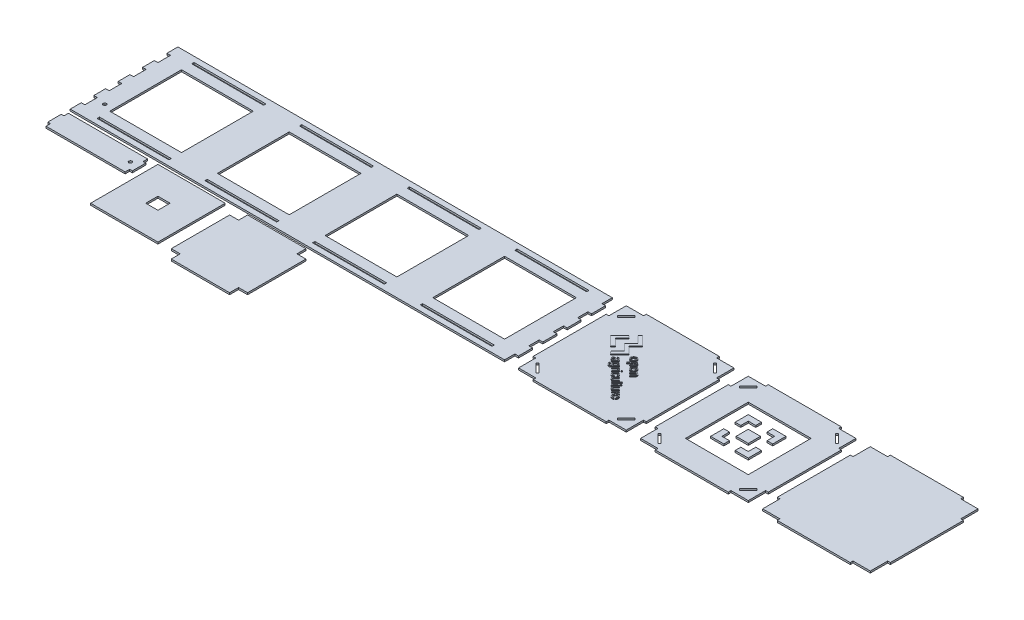
from build123d import *

# Parameters (mm, degrees)
BOSS_EXTRUDE1_DEPTH    = 2.54
SKETCH5_R              = 2.2225
SKETCH5_W              = 101.6
SKETCH5_H              = 3.302
SKETCH5_H_2            = 101.6
CUT_EXTRUDE2_DEPTH     = 394.536094914
BOSS_EXTRUDE2_DEPTH    = 2.54
SKETCH6_W              = 88.9
SKETCH6_H              = 88.9
BOSS_EXTRUDE2_2_DEPTH  = 2.54
BOSS_EXTRUDE2_3_DEPTH  = 2.54
BOSS_EXTRUDE3_DEPTH    = 2.54
CUT_EXTRUDE3_DEPTH     = 759.690500938
SKETCH9_W              = 95.25
SKETCH9_H              = 95.25
SKETCH9_W_2            = 17.272
SKETCH9_H_2            = 17.272
BOSS_EXTRUDE4_DEPTH    = 2.54
BOSS_EXTRUDE5_DEPTH    = 2.54
SKETCH14_R             = 2.2225
CUT_EXTRUDE4_DEPTH     = 774.345122438
SKETCH15_W             = 17.272
SKETCH15_H             = 17.272
BOSS_EXTRUDE6_DEPTH    = 2.54
BOSS_EXTRUDE6_2_DEPTH  = 2.54
BOSS_EXTRUDE6_3_DEPTH  = 2.54
BOSS_EXTRUDE6_4_DEPTH  = 2.54
BOSS_EXTRUDE6_5_DEPTH  = 2.54
BOSS_EXTRUDE7_DEPTH    = 3.81
BOSS_EXTRUDE7_2_DEPTH  = 3.81
BOSS_EXTRUDE7_3_DEPTH  = 3.81
BOSS_EXTRUDE7_4_DEPTH  = 3.81
BOSS_EXTRUDE7_5_DEPTH  = 3.81
BOSS_EXTRUDE7_6_DEPTH  = 3.81
BOSS_EXTRUDE7_7_DEPTH  = 3.81
BOSS_EXTRUDE7_8_DEPTH  = 3.81
BOSS_EXTRUDE7_9_DEPTH  = 3.81
BOSS_EXTRUDE7_10_DEPTH = 3.81
BOSS_EXTRUDE7_11_DEPTH = 3.81
BOSS_EXTRUDE7_12_DEPTH = 3.81
BOSS_EXTRUDE7_13_DEPTH = 3.81
BOSS_EXTRUDE7_14_DEPTH = 3.81
BOSS_EXTRUDE7_15_DEPTH = 3.81
BOSS_EXTRUDE7_16_DEPTH = 3.81
BOSS_EXTRUDE7_17_DEPTH = 3.81
BOSS_EXTRUDE7_18_DEPTH = 3.81


with BuildPart() as part:
    # Sketch1 → Boss-Extrude1 (new body)
    with BuildSketch(Plane(origin=(0, 0, 0), x_dir=(1, 0, 0), z_dir=(0, 1, 0))):
        Polygon((76.2, 76.2), (228.6, 76.2), (228.6, 61.6712), (233.68, 61.6712), (233.68, 41.7322), (228.6, 41.7322), (228.6, 27.2034), (233.68, 27.2034), (233.68, 7.2644), (228.6, 7.2644), (228.6, -7.2644), (233.68, -7.2644), (233.68, -27.2034), (228.6, -27.2034), (228.6, -41.7322), (233.68, -41.7322), (233.68, -61.6712), (228.6, -61.6712), (228.6, -76.2), (76.2, -76.2), (-76.2, -76.2), (-228.6, -76.2), (-381, -76.2), (-386.08, -76.2), (-386.08, -60.5917), (-381, -60.5917), (-381, -42.8117), (-386.08, -42.8117), (-386.08, -26.1239), (-381, -26.1239), (-381, -8.3439), (-386.08, -8.3439), (-386.08, 8.3439), (-381, 8.3439), (-381, 26.1239), (-386.08, 26.1239), (-386.08, 42.8117), (-381, 42.8117), (-381, 60.5917), (-386.08, 60.5917), (-386.08, 76.2), (-381, 76.2), (-228.6, 76.2), (-76.2, 76.2), align=None)
    extrude(amount=BOSS_EXTRUDE1_DEPTH)

    # Sketch5 → Cut-Extrude2 (cut, through all)
    with BuildSketch(Plane(origin=(0, 2.54, 0), x_dir=(1, 0, 0), z_dir=(0, 1, 0))):
        with Locations((-367.6, -45.8)):
            Circle(SKETCH5_R)
        with Locations((-304.8, -66.929)):
            Rectangle(SKETCH5_W, SKETCH5_H)
        with Locations((-152.4, -66.929)):
            Rectangle(SKETCH5_W, SKETCH5_H)
        with Locations((0, -66.929)):
            Rectangle(SKETCH5_W, SKETCH5_H)
        with Locations((152.4, -66.929)):
            Rectangle(SKETCH5_W, SKETCH5_H)
        with Locations((152.4, 66.929)):
            Rectangle(SKETCH5_W, SKETCH5_H)
        with Locations((0, 66.929)):
            Rectangle(SKETCH5_W, SKETCH5_H)
        with Locations((-152.4, 66.929)):
            Rectangle(SKETCH5_W, SKETCH5_H)
        with Locations((-304.8, 66.929)):
            Rectangle(SKETCH5_W, SKETCH5_H)
        with Locations((-304.8, 0)):
            Rectangle(SKETCH5_W, SKETCH5_H_2)
        with Locations((-152.4, 0)):
            Rectangle(SKETCH5_W, SKETCH5_H_2)
        Rectangle(SKETCH5_W, SKETCH5_H_2)
        with Locations((152.4, 0)):
            Rectangle(SKETCH5_W, SKETCH5_H_2)
    extrude(amount=-CUT_EXTRUDE2_DEPTH, mode=Mode.SUBTRACT)


with BuildPart() as body_2:
    # Sketch6 → Boss-Extrude2 (new body)
    with BuildSketch(Plane(origin=(0, 0, 0), x_dir=(1, 0, 0), z_dir=(0, 1, 0))):
        Polygon((248.376889261, 51.689), (248.376889261, 76.2), (272.887889261, 76.2), (272.887889261, 80.01), (376.265889261, 80.01), (376.265889261, 76.2), (400.776889261, 76.2), (400.776889261, 51.689), (404.586889261, 51.689), (404.586889261, -51.689), (400.776889261, -51.689), (400.776889261, -76.2), (376.265889261, -76.2), (376.265889261, -80.01), (272.887889261, -80.01), (272.887889261, -76.2), (248.376889261, -76.2), (248.376889261, -51.689), (244.566889261, -51.689), (244.566889261, 51.689), align=None)
    extrude(amount=BOSS_EXTRUDE2_DEPTH)


with BuildPart() as body_3:
    # Sketch6 → Boss-Extrude2 2 (new body)
    with BuildSketch(Plane(origin=(0, 0, 0), x_dir=(1, 0, 0), z_dir=(0, 1, 0))):
        Polygon((417.286889261, 51.689), (417.286889261, -51.689), (421.096889261, -51.689), (421.096889261, -76.2), (445.607889261, -76.2), (445.607889261, -80.01), (548.985889261, -80.01), (548.985889261, -76.2), (573.496889261, -76.2), (573.496889261, -51.689), (577.306889261, -51.689), (577.306889261, 51.689), (573.496889261, 51.689), (573.496889261, 76.2), (548.985889261, 76.2), (548.985889261, 80.01), (445.607889261, 80.01), (445.607889261, 76.2), (421.096889261, 76.2), (421.096889261, 51.689), align=None)
        with Locations((497.296889261, 0)):
            Rectangle(SKETCH6_W, SKETCH6_H, mode=Mode.SUBTRACT)
    extrude(amount=BOSS_EXTRUDE2_2_DEPTH)


with BuildPart() as body_4:
    # Sketch6 → Boss-Extrude2 3 (new body)
    with BuildSketch(Plane(origin=(0, 0, 0), x_dir=(1, 0, 0), z_dir=(0, 1, 0))):
        Polygon((590.006889261, 51.689), (590.006889261, -51.689), (593.816889261, -51.689), (593.816889261, -76.2), (618.327889261, -76.2), (618.327889261, -80.01), (721.705889261, -80.01), (721.705889261, -76.2), (746.216889261, -76.2), (746.216889261, -51.689), (750.026889261, -51.689), (750.026889261, 51.689), (746.216889261, 51.689), (746.216889261, 76.2), (721.705889261, 76.2), (721.705889261, 80.01), (618.327889261, 80.01), (618.327889261, 76.2), (593.816889261, 76.2), (593.816889261, 51.689), align=None)
    extrude(amount=BOSS_EXTRUDE2_3_DEPTH)


with BuildPart() as body_5:
    # Sketch7 → Boss-Extrude3 (new body)
    with BuildSketch(Plane(origin=(0, 0, 0), x_dir=(1, 0, 0), z_dir=(0, 1, 0))):
        Polygon((-382.27, -82.55), (-270.256, -82.55), (-270.256, -88.9), (-266.446, -88.9), (-266.446, -107.95), (-270.256, -107.95), (-270.256, -114.3), (-382.27, -114.3), (-382.27, -107.95), (-386.08, -107.95), (-386.08, -88.9), (-382.27, -88.9), align=None)
    extrude(amount=BOSS_EXTRUDE3_DEPTH)

    # Sketch14 → Cut-Extrude4 (cut, through all)
    with BuildSketch(Plane(origin=(0, 2.54, 0), x_dir=(1, 0, 0), z_dir=(0, 1, 0))):
        with Locations((-278.6685, -98.425)):
            Circle(SKETCH14_R)
    extrude(amount=-CUT_EXTRUDE4_DEPTH, mode=Mode.SUBTRACT)


with BuildPart() as cut_extrude3_tool:
    # Sketch8 → Cut-Extrude3 (new, through all)
    with BuildSketch(Plane(origin=(0, 2.54, 0), x_dir=(1, 0, 0), z_dir=(0, 1, 0))):
        Polygon((254.346209976, -57.658320715), (266.918568545, -70.230679285), (269.253435137, -67.895812693), (256.681076567, -55.323454124), align=None)
        Polygon((269.253435137, 67.895812693), (256.681076567, 55.323454124), (254.346209976, 57.658320715), (266.918568545, 70.230679285), align=None)
        Polygon((392.472701954, 55.323454124), (379.900343384, 67.895812693), (382.235209976, 70.230679285), (394.807568545, 57.658320715), align=None)
        Polygon((379.900343384, -67.895812693), (392.472701954, -55.323454124), (394.807568545, -57.658320715), (382.235209976, -70.230679285), align=None)
        Polygon((427.066209976, -57.658320715), (429.401076567, -55.323454124), (441.973435137, -67.895812693), (439.638568545, -70.230679285), align=None)
        Polygon((429.401076567, 55.323454124), (427.066209976, 57.658320715), (439.638568545, 70.230679285), (441.973435137, 67.895812693), align=None)
        Polygon((552.620343384, 67.895812693), (554.955209976, 70.230679285), (567.527568545, 57.658320715), (565.192701954, 55.323454124), align=None)
        Polygon((565.192701954, -55.323454124), (567.527568545, -57.658320715), (554.955209976, -70.230679285), (552.620343384, -67.895812693), align=None)
    extrude(amount=-CUT_EXTRUDE3_DEPTH)


with BuildPart() as body_2_1:
    add(body_2.part)

    # Cut-Extrude3: cut by cut_extrude3_tool
    add(cut_extrude3_tool.part, mode=Mode.SUBTRACT)


with BuildPart() as body_3_1:
    add(body_3.part)

    # Cut-Extrude3: cut by cut_extrude3_tool
    add(cut_extrude3_tool.part, mode=Mode.SUBTRACT)


with BuildPart() as body_6:
    # Sketch9 → Boss-Extrude4 (new body)
    with BuildSketch(Plane(origin=(0, 0, 0), x_dir=(1, 0, 0), z_dir=(0, 1, 0))):
        with Locations((-208.674723775, -129.521926765)):
            Rectangle(SKETCH9_W, SKETCH9_H)
        with Locations((-208.674723775, -129.521926765)):
            Rectangle(SKETCH9_W_2, SKETCH9_H_2, mode=Mode.SUBTRACT)
    extrude(amount=BOSS_EXTRUDE4_DEPTH)


with BuildPart() as body_7:
    # Sketch11 → Boss-Extrude5 (new body)
    with BuildSketch(Plane(origin=(0, 0, 0), x_dir=(1, 0, 0), z_dir=(0, 1, 0))):
        Polygon((-130.813413061, -93.206605574), (-143.513413061, -93.206605574), (-143.513413061, -175.756605574), (-130.813413061, -175.756605574), (-130.813413061, -188.456605574), (-48.263413061, -188.456605574), (-48.263413061, -175.756605574), (-35.563413061, -175.756605574), (-35.563413061, -93.206605574), (-48.263413061, -93.206605574), (-48.263413061, -80.506605574), (-130.813413061, -80.506605574), align=None)
    extrude(amount=BOSS_EXTRUDE5_DEPTH)


with BuildPart() as body_8:
    # Sketch15 → Boss-Extrude6 (new body)
    with BuildSketch(Plane(origin=(0, 2.54, 0), x_dir=(1, 0, 0), z_dir=(0, 1, 0))):
        with Locations((497.296889261, 0)):
            Rectangle(SKETCH15_W, SKETCH15_H)
    extrude(amount=BOSS_EXTRUDE6_DEPTH)


with BuildPart() as body_9:
    # Sketch15 → Boss-Extrude6 2 (new body)
    with BuildSketch(Plane(origin=(0, 2.54, 0), x_dir=(1, 0, 0), z_dir=(0, 1, 0))):
        Polygon((470.660889261, -8), (478.660889261, -8), (478.660889261, -18.636), (489.296889261, -18.636), (489.296889261, -26.636), (470.660889261, -26.636), align=None)
    extrude(amount=BOSS_EXTRUDE6_2_DEPTH)


with BuildPart() as body_10:
    # Sketch15 → Boss-Extrude6 3 (new body)
    with BuildSketch(Plane(origin=(0, 2.54, 0), x_dir=(1, 0, 0), z_dir=(0, 1, 0))):
        Polygon((470.660889261, 8), (478.660889261, 8), (478.660889261, 18.636), (489.296889261, 18.636), (489.296889261, 26.636), (470.660889261, 26.636), align=None)
    extrude(amount=BOSS_EXTRUDE6_3_DEPTH)


with BuildPart() as body_11:
    # Sketch15 → Boss-Extrude6 4 (new body)
    with BuildSketch(Plane(origin=(0, 2.54, 0), x_dir=(1, 0, 0), z_dir=(0, 1, 0))):
        Polygon((505.296889261, 18.636), (505.296889261, 26.636), (523.932889261, 26.636), (523.932889261, 8), (515.932889261, 8), (515.932889261, 18.636), align=None)
    extrude(amount=BOSS_EXTRUDE6_4_DEPTH)


with BuildPart() as body_12:
    # Sketch15 → Boss-Extrude6 5 (new body)
    with BuildSketch(Plane(origin=(0, 2.54, 0), x_dir=(1, 0, 0), z_dir=(0, 1, 0))):
        Polygon((515.932889261, -8), (523.932889261, -8), (523.932889261, -26.636), (505.296889261, -26.636), (505.296889261, -18.636), (515.932889261, -18.636), align=None)
    extrude(amount=BOSS_EXTRUDE6_5_DEPTH)


with BuildPart() as body_13:
    # Sketch13 → Boss-Extrude7 (new body)
    with BuildSketch(Plane(origin=(0, 0, 0), x_dir=(1, 0, 0), z_dir=(0, 1, 0))):
        Polygon((297.611867333, 50.056017059), (310.506125104, 37.161759289), (300.926880412, 27.582514597), (310.483262944, 18.026132065), (297.437549979, 4.9804191), (294.421756704, 8.41175471), (303.990409741, 17.980407747), (294.456889368, 27.51392812), (304.081858377, 37.13889713), (294.38830289, 46.832452617), align=None)
    extrude(amount=BOSS_EXTRUDE7_DEPTH)


with BuildPart() as body_14:
    # Sketch13 → Boss-Extrude7 2 (new body)
    with BuildSketch(Plane(origin=(0, 0, 0), x_dir=(1, 0, 0), z_dir=(0, 1, 0))):
        Polygon((288.032622642, 40.476772368), (291.279049243, 37.230345766), (281.608355916, 27.559652438), (291.256187084, 17.91182127), (288.009760483, 14.665394668), (275.115502712, 27.559652438), align=None)
    extrude(amount=BOSS_EXTRUDE7_2_DEPTH)


with BuildPart() as body_15:
    # Sketch13 → Boss-Extrude7 3 (new body)
    with BuildSketch(Plane(origin=(0, 0, 0), x_dir=(1, 0, 0), z_dir=(0, 1, 0))):
        with BuildLine():
            add(Edge.make_bspline(
                [(317.407406634, 17.75886108), (317.538319075, 17.883980578), (317.791961127, 18.12639884), (318.192456073, 18.444663074), (318.593354141, 18.712225684), (318.99813423, 18.925134943), (319.406205405, 19.082916939), (319.815475759, 19.18829985), (320.227454635, 19.241229454), (320.50108102, 19.232427037), (320.637767083, 19.228029918)],
                knots=[0, 0, 0, 0, 1.186268835, 2.29838861, 3.347622772, 4.340760743, 5.289430453, 6.208163956, 7.10491449, 8, 8, 8, 8], degree=3))
            add(Edge.make_bspline(
                [(320.637767083, 19.228029918), (320.750514187, 19.216584404), (320.974651266, 19.193831145), (321.303468653, 19.122089356), (321.62364624, 19.022348792), (321.932691293, 18.889988052), (322.234143385, 18.73187131), (322.522823281, 18.538624965), (322.803522316, 18.318139595), (322.978287624, 18.151228789), (323.066762711, 18.066730051)],
                knots=[0, 0, 0, 0, 0.987662547, 1.963436672, 2.929173307, 3.908204045, 4.891450055, 5.893477774, 6.933571322, 8, 8, 8, 8], degree=3))
            add(Edge.make_bspline(
                [(323.066762711, 18.066730051), (323.160772612, 17.968853203), (323.345060729, 17.77698469), (323.583566582, 17.464785136), (323.783404463, 17.140925598), (323.950941003, 16.808894731), (324.075283201, 16.463388527), (324.165116989, 16.108677022), (324.213535564, 15.742637682), (324.228292773, 15.36877006), (324.200835769, 14.992256277), (324.133005817, 14.617699922), (324.020323939, 14.249332592), (323.867447417, 13.885583651), (323.673806084, 13.525980209), (323.436223307, 13.172272442), (323.157982937, 12.822725292), (322.946404675, 12.60338486), (322.838124725, 12.491132444)],
                knots=[0, 0, 0, 0, 1.034461854, 2.027861155, 2.989304727, 3.933892061, 4.858777658, 5.784218179, 6.719413939, 7.669647433, 8.633241754, 9.592754162, 10.566810006, 11.565115177, 12.597670157, 13.676702502, 14.811000084, 16, 16, 16, 16], degree=3))
            add(Edge.make_bspline(
                [(322.838124725, 12.491132444), (322.747563607, 12.402812666), (322.571260925, 12.230873382), (322.301536745, 11.992942072), (322.036778494, 11.780471201), (321.777968895, 11.589547925), (321.520489623, 11.428029529), (321.268691846, 11.288278817), (321.021388258, 11.174346413), (320.777561063, 11.085041276), (320.534914108, 11.019280154), (320.292825492, 10.97161773), (320.049951235, 10.942025804), (319.806304292, 10.930635981), (319.561902129, 10.937484736), (319.316773022, 10.962519363), (319.071654631, 11.005715543), (318.746541336, 11.087440786), (318.349830588, 11.229185067), (317.899061985, 11.458896305), (317.477348891, 11.748582996), (317.226575254, 11.981508812), (317.099537664, 12.099505004)],
                knots=[0, 0, 0, 0, 1.163023078, 2.264151458, 3.305487156, 4.283897768, 5.21942255, 6.098217622, 6.930274279, 7.720458485, 8.482955048, 9.23952534, 9.987391776, 10.730609024, 11.480243582, 12.233465849, 12.994319098, 13.766726775, 15.313924267, 16.85613531, 18.407372489, 20, 20, 20, 20], degree=3))
            add(Edge.make_bspline(
                [(317.099537664, 12.099505004), (317.003948848, 12.198850731), (316.816518283, 12.393647847), (316.574932168, 12.710406195), (316.368375528, 13.034143314), (316.205472229, 13.370973084), (316.074037969, 13.714690792), (315.986157614, 14.070574676), (315.936049633, 14.434812607), (315.924976373, 14.806616888), (315.953050848, 15.182904937), (316.030208448, 15.55906107), (316.14726749, 15.933984819), (316.313895393, 16.304887719), (316.520121654, 16.675458278), (316.774035543, 17.041777251), (317.068461868, 17.408658746), (317.292257569, 17.639887502), (317.407406634, 17.75886108)],
                knots=[0, 0, 0, 0, 1.030513595, 2.02063121, 2.974345938, 3.898264539, 4.814565348, 5.722202171, 6.633814384, 7.559937305, 8.499787891, 9.449569274, 10.426062291, 11.431871067, 12.485589143, 13.594048329, 14.762071455, 16, 16, 16, 16], degree=3))
        make_face()
        with BuildLine():
            add(Edge.make_bspline(
                [(318.401189561, 16.765078153), (318.314164514, 16.674708634), (318.145770974, 16.499843539), (317.917209675, 16.230209983), (317.725080837, 15.960374112), (317.562239996, 15.693745261), (317.42967559, 15.42953131), (317.331211131, 15.166221902), (317.26734728, 14.904675921), (317.232780489, 14.647296356), (317.229109006, 14.395292578), (317.248574891, 14.152406229), (317.294681856, 13.918688838), (317.364239304, 13.694312906), (317.461117877, 13.479116619), (317.581237537, 13.273773322), (317.724449773, 13.075642192), (317.838279037, 12.956930292), (317.896374999, 12.896342339)],
                knots=[0, 0, 0, 0, 1.36859487, 2.64823223, 3.852142833, 4.978817027, 6.053869975, 7.072335014, 8.038728663, 8.985318007, 9.899269028, 10.783252433, 11.638952855, 12.492988411, 13.340571711, 14.207524068, 15.085159561, 16, 16, 16, 16], degree=3))
            add(Edge.make_bspline(
                [(317.896374999, 12.896342339), (317.95721269, 12.839305732), (318.077096399, 12.726912248), (318.272096689, 12.581458493), (318.477956535, 12.462060406), (318.693760146, 12.370243454), (318.917682453, 12.298379555), (319.151659057, 12.252686798), (319.395446352, 12.236555116), (319.647246821, 12.239617159), (319.906081538, 12.273161652), (320.16824565, 12.343320957), (320.433586908, 12.443497771), (320.702133007, 12.575809729), (320.972425042, 12.743117273), (321.245455271, 12.943135563), (321.523215768, 13.174277515), (321.700657561, 13.347788306), (321.792275722, 13.43737678)],
                knots=[0, 0, 0, 0, 0.901932887, 1.777303808, 2.626067113, 3.470972204, 4.310295076, 5.167072951, 6.043243316, 6.949784986, 7.88870038, 8.859184729, 9.879899313, 10.953559093, 12.093546954, 13.315270255, 14.613798942, 16, 16, 16, 16], degree=3))
            add(Edge.make_bspline(
                [(321.792275722, 13.43737678), (321.876254514, 13.524750962), (322.039308082, 13.694397035), (322.260599762, 13.956343327), (322.445995116, 14.22055632), (322.604830757, 14.480895599), (322.729432284, 14.742971055), (322.826695877, 15.002894457), (322.887499008, 15.263255763), (322.919479966, 15.519825415), (322.923724592, 15.770925333), (322.904069659, 16.014596431), (322.857697049, 16.248685468), (322.791296741, 16.474567622), (322.694645582, 16.687964007), (322.57473655, 16.890802677), (322.435919256, 17.088179442), (322.322883588, 17.205632841), (322.26539789, 17.26536523)],
                knots=[0, 0, 0, 0, 1.340044305, 2.601835549, 3.787228901, 4.906329687, 5.970052783, 6.991670078, 7.969263077, 8.919404313, 9.845797538, 10.741815179, 11.617354877, 12.480560157, 13.339682155, 14.199816671, 15.084494334, 16, 16, 16, 16], degree=3))
            add(Edge.make_bspline(
                [(322.26539789, 17.26536523), (322.204831768, 17.323501441), (322.086162641, 17.437409565), (321.888252024, 17.579670045), (321.684063384, 17.701986645), (321.468465122, 17.796262084), (321.24407824, 17.868162558), (321.010606511, 17.911779848), (320.768099015, 17.936128274), (320.517649633, 17.930132728), (320.259610181, 17.900063565), (319.99987873, 17.832135687), (319.736742864, 17.736952319), (319.472753676, 17.605656828), (319.206942547, 17.441466261), (318.935998417, 17.249152101), (318.666440614, 17.02047067), (318.491564681, 16.852094318), (318.401189561, 16.765078153)],
                knots=[0, 0, 0, 0, 0.915775482, 1.794307991, 2.655035311, 3.5110155, 4.3580632, 5.222726553, 6.100137473, 7.015022628, 7.953360786, 8.930729478, 9.939655786, 11.004770432, 12.143919957, 13.349061057, 14.630006313, 16, 16, 16, 16], degree=3))
        make_face(mode=Mode.SUBTRACT)
    extrude(amount=BOSS_EXTRUDE7_3_DEPTH)


with BuildPart() as body_16:
    # Sketch13 → Boss-Extrude7 4 (new body)
    with BuildSketch(Plane(origin=(0, 0, 0), x_dir=(1, 0, 0), z_dir=(0, 1, 0))):
        with BuildLine():
            Line((318.87044082, 6.208590624), (326.76863816, 14.106787964))
            Line((326.76863816, 14.106787964), (327.649233966, 13.226192159))
            Line((327.649233966, 13.226192159), (326.908990191, 12.485948384))
            add(Edge.make_bspline(
                [(326.908990191, 12.485948384), (327.030240722, 12.503034943), (327.26668046, 12.536353903), (327.616774823, 12.53921366), (327.949765388, 12.50959622), (328.267702221, 12.4377482), (328.575225796, 12.326882616), (328.872738336, 12.164176139), (329.164133542, 11.955137278), (329.342941984, 11.785705927), (329.435326743, 11.698166018)],
                knots=[0, 0, 0, 0, 1.062451816, 2.071791573, 3.033006336, 3.959941409, 4.894995912, 5.862623595, 6.895684096, 8, 8, 8, 8], degree=3))
            add(Edge.make_bspline(
                [(329.435326743, 11.698166018), (329.494402934, 11.637169747), (329.610977142, 11.516806673), (329.767200108, 11.322816745), (329.907034726, 11.123503469), (330.034307635, 10.919870582), (330.136581062, 10.705970703), (330.225948588, 10.487797787), (330.298928117, 10.263307188), (330.352689787, 10.033016204), (330.38916594, 9.799191433), (330.407257595, 9.563046131), (330.407198444, 9.325424005), (330.389086465, 9.087027917), (330.352197519, 8.848052821), (330.298329267, 8.607095844), (330.222353113, 8.36585749), (330.101542713, 8.04128699), (329.910795638, 7.644090615), (329.629801439, 7.186945833), (329.298886199, 6.746710569), (329.042715757, 6.477059019), (328.912402242, 6.339887685)],
                knots=[0, 0, 0, 0, 0.841657938, 1.660831649, 2.466290044, 3.255493321, 4.038536277, 4.813855133, 5.592344745, 6.37638803, 7.156314635, 7.936779429, 8.722427717, 9.510353046, 10.305070349, 11.118276376, 11.956100773, 12.810827895, 14.55118152, 16.314386105, 18.12513381, 20, 20, 20, 20], degree=3))
            add(Edge.make_bspline(
                [(328.912402242, 6.339887685), (328.766549293, 6.200811714), (328.480882716, 5.928418478), (328.01216936, 5.581952325), (327.529528076, 5.290358562), (327.108697084, 5.103271121), (326.769974994, 4.983869585), (326.518036908, 4.915543813), (326.267438122, 4.867934485), (326.017822727, 4.838491304), (325.768858425, 4.826274169), (325.521422838, 4.836275829), (325.275265941, 4.862699956), (325.032722737, 4.910922776), (324.795421199, 4.97416097), (324.56630771, 5.051261945), (324.346541975, 5.141152455), (324.13705105, 5.246993735), (323.93583805, 5.362615658), (323.746992561, 5.496831001), (323.565012058, 5.639757343), (323.453646746, 5.74730571), (323.397925681, 5.801116986)],
                knots=[0, 0, 0, 0, 1.948236235, 3.815802016, 5.626327613, 7.394312547, 8.260165298, 9.099637512, 9.917236333, 10.725920158, 11.529844255, 12.326173937, 13.119519406, 13.922780199, 14.71615926, 15.494206535, 16.260240646, 17.011200995, 17.763756683, 18.503020843, 19.250994123, 20, 20, 20, 20], degree=3))
            add(Edge.make_bspline(
                [(323.397925681, 5.801116986), (323.320821823, 5.882148939), (323.170005042, 6.040649155), (322.988047836, 6.308029082), (322.83422662, 6.581711645), (322.727656305, 6.871474991), (322.65363443, 7.163216838), (322.61037973, 7.453685718), (322.594796159, 7.739836328), (322.60959341, 7.928332574), (322.616934542, 8.021848311)],
                knots=[0, 0, 0, 0, 1.100351843, 2.152311531, 3.177118604, 4.18659836, 5.183846222, 6.13864077, 7.076552544, 8, 8, 8, 8], degree=3))
            Line((322.616934542, 8.021848311), (319.837058838, 5.241972606))
            Line((319.837058838, 5.241972606), (318.87044082, 6.208590624))
        make_face()
        with BuildLine():
            add(Edge.make_bspline(
                [(324.758434882, 10.344448045), (324.67036362, 10.254316868), (324.500284711, 10.080259952), (324.274315199, 9.808419786), (324.074298804, 9.545094046), (323.912762256, 9.281039842), (323.77542556, 9.025182751), (323.675448314, 8.769655973), (323.606578522, 8.518440839), (323.570340166, 8.272054149), (323.56178008, 8.034553893), (323.574894571, 7.80627599), (323.610592693, 7.588212983), (323.67035683, 7.381389537), (323.749282669, 7.183570417), (323.854924581, 6.998780052), (323.978994768, 6.821772327), (324.078662919, 6.716759746), (324.129114486, 6.663602852)],
                knots=[0, 0, 0, 0, 1.441868722, 2.784466293, 4.043825454, 5.223090317, 6.324160716, 7.363536718, 8.356699776, 9.299731998, 10.207328074, 11.072632113, 11.91327056, 12.730736547, 13.53272336, 14.344832759, 15.162161836, 16, 16, 16, 16], degree=3))
            add(Edge.make_bspline(
                [(324.129114486, 6.663602852), (324.183902381, 6.612563958), (324.291745622, 6.512100166), (324.470718079, 6.383766205), (324.661708804, 6.27939466), (324.863941174, 6.197821787), (325.07718944, 6.138338694), (325.301173655, 6.101778007), (325.537111979, 6.092755201), (325.782974742, 6.099440768), (326.037558893, 6.138917282), (326.297433036, 6.209687007), (326.561143203, 6.315419987), (326.828052111, 6.45446982), (327.099083221, 6.626614096), (327.375003537, 6.830145953), (327.653595114, 7.069848069), (327.835723591, 7.245216741), (327.929938027, 7.335934354)],
                knots=[0, 0, 0, 0, 0.829611534, 1.632988372, 2.434271262, 3.237517388, 4.045455819, 4.884506263, 5.747290444, 6.65987387, 7.607676574, 8.596115603, 9.640177013, 10.751562388, 11.928444193, 13.196874624, 14.549952852, 16, 16, 16, 16], degree=3))
            add(Edge.make_bspline(
                [(327.929938027, 7.335934354), (328.017184226, 7.425359098), (328.18562108, 7.598001833), (328.41069292, 7.867390719), (328.606297703, 8.132392643), (328.772872935, 8.393723182), (328.905119744, 8.654225637), (329.008098797, 8.90987544), (329.08027219, 9.163244844), (329.117015321, 9.412857275), (329.131985536, 9.654696034), (329.119660606, 9.886680356), (329.088806927, 10.107539514), (329.03561774, 10.317380407), (328.953638822, 10.513465551), (328.855259129, 10.700109584), (328.731099225, 10.87447419), (328.63367088, 10.979336599), (328.584159589, 11.032625743)],
                knots=[0, 0, 0, 0, 1.427067134, 2.755085056, 4.007036912, 5.188734707, 6.291523834, 7.340205397, 8.333853399, 9.293516843, 10.217504831, 11.097990232, 11.942976225, 12.762733049, 13.563266803, 14.365609255, 15.169432729, 16, 16, 16, 16], degree=3))
            add(Edge.make_bspline(
                [(328.584159589, 11.032625743), (328.531627881, 11.081377637), (328.427047693, 11.178432966), (328.251639408, 11.302325289), (328.059631284, 11.397954618), (327.857325275, 11.477544821), (327.639842388, 11.527445744), (327.409653603, 11.561019199), (327.16536662, 11.564901964), (326.90922479, 11.552901002), (326.645364973, 11.512830186), (326.378375933, 11.438958787), (326.111274693, 11.333763625), (325.841242996, 11.19873267), (325.571138775, 11.030569239), (325.298402286, 10.83201377), (325.023806425, 10.60368438), (324.848569084, 10.432498406), (324.758434882, 10.344448045)],
                knots=[0, 0, 0, 0, 0.794519013, 1.581729403, 2.371605298, 3.169072934, 3.987225915, 4.84071097, 5.745053887, 6.692232079, 7.683081044, 8.698376673, 9.758469951, 10.862749204, 12.042815462, 13.283459073, 14.602733602, 16, 16, 16, 16], degree=3))
        make_face(mode=Mode.SUBTRACT)
    extrude(amount=BOSS_EXTRUDE7_4_DEPTH)


with BuildPart() as body_17:
    # Sketch13 → Boss-Extrude7 5 (new body)
    with BuildSketch(Plane(origin=(0, 0, 0), x_dir=(1, 0, 0), z_dir=(0, 1, 0))):
        with BuildLine():
            Line((332.951575313, 0.181851698), (333.829907376, -0.940964547))
            add(Edge.make_bspline(
                [(333.829907376, -0.940964547), (333.737840393, -0.991514399), (333.556874387, -1.090874719), (333.27667194, -1.211974022), (332.998587224, -1.313738962), (332.717943434, -1.386042283), (332.436987531, -1.434147613), (332.155197382, -1.455887166), (331.873365441, -1.457561011), (331.59237651, -1.429101779), (331.31245028, -1.377765606), (331.03639545, -1.297283032), (330.763494544, -1.194151912), (330.497331475, -1.059338655), (330.232040254, -0.905110403), (329.974254913, -0.719326487), (329.718606694, -0.510707705), (329.557145424, -0.355103543), (329.47446694, -0.275424273)],
                knots=[0, 0, 0, 0, 1.053028106, 2.069822253, 3.058620621, 4.020634175, 4.972589684, 5.914227638, 6.852818409, 7.795794004, 8.742952674, 9.703655095, 10.676418069, 11.664868717, 12.693009957, 13.751546151, 14.848648005, 16, 16, 16, 16], degree=3))
            add(Edge.make_bspline(
                [(329.47446694, -0.275424273), (329.375238195, -0.171448572), (329.180920715, 0.032164768), (328.927538464, 0.359208218), (328.712845516, 0.692818563), (328.538886284, 1.034530413), (328.406290857, 1.385163375), (328.316095186, 1.744631235), (328.263152576, 2.111005925), (328.251543964, 2.483934014), (328.284059098, 2.858886636), (328.356323634, 3.232657454), (328.473413683, 3.602136783), (328.633965103, 3.967390843), (328.832872178, 4.33079093), (329.07863497, 4.687341948), (329.36413891, 5.041432693), (329.579141559, 5.266248923), (329.689522471, 5.381668061)],
                knots=[0, 0, 0, 0, 1.074983167, 2.105116017, 3.090395789, 4.039929885, 4.96916563, 5.889505663, 6.807868742, 7.734372471, 8.675067223, 9.618604982, 10.577645264, 11.568990537, 12.600113423, 13.672973656, 14.805320345, 16, 16, 16, 16], degree=3))
            add(Edge.make_bspline(
                [(329.689522471, 5.381668061), (329.808751268, 5.495763209), (330.041170728, 5.718175353), (330.405730732, 6.015381958), (330.774052313, 6.269098333), (331.14615801, 6.478076657), (331.520593783, 6.645850467), (331.899915329, 6.76582788), (332.281100022, 6.847271885), (332.664966949, 6.880157834), (333.043267155, 6.872608639), (333.414084329, 6.831308073), (333.772362627, 6.745425879), (334.121300489, 6.626814531), (334.45625033, 6.4627857), (334.780742056, 6.262796113), (335.095348376, 6.024552352), (335.288735341, 5.84016675), (335.387362169, 5.746130593)],
                knots=[0, 0, 0, 0, 1.228738537, 2.395249745, 3.498915726, 4.555726217, 5.569738388, 6.549065168, 7.513507499, 8.467031543, 9.411352227, 10.328042492, 11.240034763, 12.150033454, 13.067498642, 14.011150141, 14.985691961, 16, 16, 16, 16], degree=3))
            add(Edge.make_bspline(
                [(335.387362169, 5.746130593), (335.478246932, 5.650410904), (335.656676826, 5.462488823), (335.888357979, 5.157716549), (336.081677052, 4.841107317), (336.240628767, 4.514591794), (336.354293469, 4.174438185), (336.438462181, 3.825601321), (336.480567232, 3.463971183), (336.484597699, 3.093816185), (336.451465376, 2.718652686), (336.374020335, 2.344200783), (336.252334771, 1.973745351), (336.090094483, 1.605576841), (335.882796653, 1.242078466), (335.633979094, 0.880590207), (335.34362792, 0.521450104), (335.124313498, 0.294157667), (335.011580925, 0.177324213)],
                knots=[0, 0, 0, 0, 1.005380171, 1.973816848, 2.910769534, 3.829023172, 4.734675415, 5.638554931, 6.559415896, 7.502595184, 8.455367852, 9.424163016, 10.409827774, 11.421716177, 12.485231782, 13.593813354, 14.763165641, 16, 16, 16, 16], degree=3))
            add(Edge.make_bspline(
                [(335.011580925, 0.177324213), (334.975449348, 0.141767643), (334.8887235, 0.056421971), (334.800471439, -0.027346151), (334.748986803, -0.076214939)],
                knots=[0, 0, 0, 0, 0.833236632, 2, 2, 2, 2], degree=3))
            Line((334.748986803, -0.076214939), (330.490887291, 4.181884573))
            add(Edge.make_bspline(
                [(330.490887291, 4.181884573), (330.420394772, 4.099754692), (330.283437834, 3.940188015), (330.10066884, 3.692064209), (329.946802963, 3.443413806), (329.819189249, 3.195024545), (329.715565401, 2.949042704), (329.643281874, 2.701215642), (329.593957813, 2.455137585), (329.576982742, 2.209641818), (329.583606555, 1.970084739), (329.61304729, 1.737229096), (329.665108043, 1.51263678), (329.739998821, 1.29510893), (329.840842313, 1.087548779), (329.960827207, 0.886066329), (330.107157566, 0.695070484), (330.218896027, 0.577031639), (330.27583176, 0.516885578)],
                knots=[0, 0, 0, 0, 1.2666329, 2.46088755, 3.603153014, 4.685554941, 5.727148005, 6.722080354, 7.702557712, 8.659110508, 9.595759125, 10.503989627, 11.401722498, 12.290020001, 13.190789426, 14.098160511, 15.030927885, 16, 16, 16, 16], degree=3))
            add(Edge.make_bspline(
                [(330.27583176, 0.516885578), (330.364853176, 0.434851294), (330.538343442, 0.27497797), (330.830892741, 0.087378247), (331.140232308, -0.044079196), (331.46586492, -0.123382859), (331.811872069, -0.140651231), (332.176667631, -0.094042573), (332.562853352, 0.011655112), (332.817811617, 0.123285096), (332.951575313, 0.181851698)],
                knots=[0, 0, 0, 0, 0.999212959, 1.947326047, 2.85556077, 3.766254953, 4.703141512, 5.701887185, 6.794296528, 8, 8, 8, 8], degree=3))
        make_face()
        with BuildLine():
            Line((331.339790703, 4.922128348), (334.527140045, 1.734779006))
            add(Edge.make_bspline(
                [(334.527140045, 1.734779006), (334.579970239, 1.799074006), (334.6822618, 1.923564101), (334.818946068, 2.114994926), (334.935701929, 2.302350282), (335.03771576, 2.483827424), (335.117132917, 2.66378944), (335.177810274, 2.839572371), (335.223235256, 3.011212269), (335.23765676, 3.125249514), (335.244746396, 3.181310419)],
                knots=[0, 0, 0, 0, 1.218562223, 2.359420264, 3.441879933, 4.450931485, 5.405876783, 6.318105409, 7.17317775, 8, 8, 8, 8], degree=3))
            add(Edge.make_bspline(
                [(335.244746396, 3.181310419), (335.250535542, 3.26504874), (335.26191148, 3.429598393), (335.244193446, 3.673294059), (335.204667776, 3.908293553), (335.135649206, 4.133656531), (335.041629618, 4.350418366), (334.924255057, 4.559506082), (334.7780289, 4.758527301), (334.662870357, 4.878843414), (334.604107288, 4.940238287)],
                knots=[0, 0, 0, 0, 1.038386599, 2.040477436, 3.017637282, 3.984373792, 4.951336128, 5.938941949, 6.948283868, 8, 8, 8, 8], degree=3))
            add(Edge.make_bspline(
                [(334.604107288, 4.940238287), (334.548535601, 4.993480303), (334.438869923, 5.098548586), (334.258876532, 5.233730937), (334.072819279, 5.350272771), (333.87937967, 5.445600642), (333.679619015, 5.521695487), (333.471065472, 5.572573229), (333.25617809, 5.608032958), (333.034612613, 5.617769683), (332.811673922, 5.610005917), (332.591165212, 5.577397909), (332.373589477, 5.524799933), (332.158194991, 5.450822856), (331.947817026, 5.349678913), (331.741060098, 5.228433934), (331.534947314, 5.088355746), (331.405958074, 4.978487341), (331.339790703, 4.922128348)],
                knots=[0, 0, 0, 0, 1.017445776, 2.007836879, 2.971913462, 3.918461815, 4.856760763, 5.79383731, 6.754029083, 7.733694342, 8.722877036, 9.70132064, 10.677163149, 11.681197539, 12.708344405, 13.759707885, 14.850801493, 16, 16, 16, 16], degree=3))
        make_face(mode=Mode.SUBTRACT)
    extrude(amount=BOSS_EXTRUDE7_5_DEPTH)


with BuildPart() as body_18:
    # Sketch13 → Boss-Extrude7 6 (new body)
    with BuildSketch(Plane(origin=(0, 0, 0), x_dir=(1, 0, 0), z_dir=(0, 1, 0))):
        with BuildLine():
            Line((333.352914299, -3.895804995), (339.062072709, 1.813353415))
            Line((339.062072709, 1.813353415), (339.931349802, 0.944076322))
            Line((339.931349802, 0.944076322), (339.120930012, 0.133656532))
            add(Edge.make_bspline(
                [(339.120930012, 0.133656532), (339.249610667, 0.155152597), (339.501272034, 0.197192555), (339.878813459, 0.20189711), (340.244176105, 0.164883729), (340.598204733, 0.077539117), (340.940340231, -0.056708603), (341.267885604, -0.24132582), (341.586226198, -0.468161662), (341.779151828, -0.650891777), (341.878168292, -0.744675531)],
                knots=[0, 0, 0, 0, 1.034072823, 2.022341131, 2.985896753, 3.941604482, 4.906870647, 5.893359238, 6.918795193, 8, 8, 8, 8], degree=3))
            add(Edge.make_bspline(
                [(341.878168292, -0.744675531), (341.960846632, -0.831288535), (342.122892442, -1.001046108), (342.330145016, -1.281473802), (342.505229964, -1.573129511), (342.644092628, -1.874952441), (342.749331934, -2.174710565), (342.811404636, -2.466898501), (342.834384289, -2.74660549), (342.810781923, -3.01534177), (342.747729598, -3.274289226), (342.664058452, -3.531827115), (342.540873292, -3.784007719), (342.442383803, -3.946369501), (342.392037824, -4.029365798)],
                knots=[0, 0, 0, 0, 1.18343601, 2.319481105, 3.440841462, 4.542907618, 5.600393902, 6.576827005, 7.48992582, 8.366413478, 9.231899029, 10.121760283, 11.039879088, 12, 12, 12, 12], degree=3))
            add(Edge.make_bspline(
                [(342.392037824, -4.029365798), (342.371985526, -4.058278811), (342.328352535, -4.121192359), (342.251134103, -4.216548985), (342.161591542, -4.32466117), (342.058697095, -4.4443339), (341.937548516, -4.571698408), (341.806609562, -4.713814039), (341.659110766, -4.864453493), (341.556001528, -4.968859799), (341.502387049, -5.023148725)],
                knots=[0, 0, 0, 0, 0.632195977, 1.37563286, 2.203911155, 3.15566575, 4.21123444, 5.36264247, 6.628633541, 8, 8, 8, 8], degree=3))
            Line((341.502387049, -5.023148725), (337.991322539, -8.534213235))
            Line((337.991322539, -8.534213235), (337.024704521, -7.567595217))
            Line((337.024704521, -7.567595217), (340.49728541, -4.095014328))
            add(Edge.make_bspline(
                [(340.49728541, -4.095014328), (340.589193923, -4.001192037), (340.760229964, -3.826594573), (340.979400327, -3.564522944), (341.149785905, -3.327870139), (341.272113346, -3.107625318), (341.34448799, -2.892631755), (341.38281975, -2.676499267), (341.378902673, -2.452846243), (341.339492638, -2.225774716), (341.266769324, -1.999351285), (341.160782723, -1.778461906), (341.014672691, -1.569797546), (340.897306815, -1.443555788), (340.836846774, -1.378523412)],
                knots=[0, 0, 0, 0, 1.499930215, 2.791277068, 3.898606741, 4.828080139, 5.656794353, 6.478755934, 7.323588196, 8.197984653, 9.103073905, 10.032227458, 10.986318569, 12, 12, 12, 12], degree=3))
            add(Edge.make_bspline(
                [(340.836846774, -1.378523412), (340.78477846, -1.329377616), (340.681865898, -1.232241388), (340.516241542, -1.10306222), (340.34362473, -0.991498973), (340.164075803, -0.897954125), (339.977137064, -0.823636033), (339.783700568, -0.763389095), (339.582586408, -0.723983717), (339.374434231, -0.698860954), (339.157822038, -0.703215288), (338.932310235, -0.742341879), (338.701404633, -0.822271771), (338.461008988, -0.934225898), (338.215541282, -1.085645383), (337.960977379, -1.270708843), (337.698019035, -1.490322272), (337.527641267, -1.656499962), (337.438969386, -1.742985943)],
                knots=[0, 0, 0, 0, 0.879559495, 1.73844153, 2.577008007, 3.402395563, 4.222085135, 5.046377977, 5.888423998, 6.737386324, 7.618557585, 8.540926169, 9.537981856, 10.612500164, 11.7941625, 13.075944058, 14.478196164, 16, 16, 16, 16], degree=3))
            Line((337.438969386, -1.742985943), (334.319532317, -4.862423012))
            Line((334.319532317, -4.862423012), (333.352914299, -3.895804995))
        make_face()
    extrude(amount=BOSS_EXTRUDE7_6_DEPTH)


with BuildPart() as body_19:
    # Sketch13 → Boss-Extrude7 7 (new body)
    with BuildSketch(Plane(origin=(0, 0, 0), x_dir=(1, 0, 0), z_dir=(0, 1, 0))):
        with BuildLine():
            add(Edge.make_bspline(
                [(306.715679603, -1.841697002), (306.55612391, -1.826104182), (306.247442164, -1.795937793), (305.806281059, -1.711388393), (305.40245282, -1.602172152), (305.034475185, -1.460242829), (304.695022079, -1.285137363), (304.374430176, -1.078757625), (304.064019893, -0.844936795), (303.875190593, -0.663553348), (303.77960567, -0.571737498)],
                knots=[0, 0, 0, 0, 1.174519637, 2.27226471, 3.288032943, 4.237073693, 5.157246721, 6.082409329, 7.029320373, 8, 8, 8, 8], degree=3))
            add(Edge.make_bspline(
                [(303.77960567, -0.571737498), (303.704292698, -0.494478997), (303.557780815, -0.344182331), (303.366867191, -0.105041177), (303.198133813, 0.131244851), (303.060811255, 0.370340131), (302.950110442, 0.610326567), (302.868596819, 0.85089774), (302.812507544, 1.091945835), (302.788948134, 1.332976318), (302.787969846, 1.569702195), (302.813774034, 1.800207529), (302.860592221, 2.023749784), (302.933989725, 2.238932971), (303.028892908, 2.4469695), (303.151207559, 2.644263215), (303.293628134, 2.836666234), (303.405511862, 2.954050171), (303.46268173, 3.014030512)],
                knots=[0, 0, 0, 0, 1.274542885, 2.479462344, 3.612764223, 4.70357352, 5.733308267, 6.731782305, 7.701149466, 8.651663201, 9.588180671, 10.494348232, 11.388274202, 12.282378139, 13.176304109, 14.084926463, 15.021443932, 16, 16, 16, 16], degree=3))
            add(Edge.make_bspline(
                [(303.46268173, 3.014030512), (303.533633419, 3.079941801), (303.673354087, 3.209736728), (303.906597671, 3.371905586), (304.155278664, 3.499226488), (304.41565026, 3.593715384), (304.682203251, 3.65780179), (304.949924439, 3.686776215), (305.215188698, 3.685167744), (305.476906635, 3.649881895), (305.735467149, 3.587538019), (305.991452457, 3.503813306), (306.244527215, 3.397199932), (306.406970396, 3.309670538), (306.48930536, 3.265305922)],
                knots=[0, 0, 0, 0, 1.061201662, 2.089757238, 3.10396142, 4.117219642, 5.120935111, 6.103441838, 7.063522966, 8.023354356, 8.992948499, 9.977022584, 10.974645953, 12, 12, 12, 12], degree=3))
            add(Edge.make_bspline(
                [(306.48930536, 3.265305922), (306.555241421, 3.22501222), (306.701902806, 3.135387061), (306.936456772, 2.976663045), (307.205899272, 2.778479216), (307.39518039, 2.631197704), (307.496670741, 2.552227056)],
                knots=[0, 0, 0, 0, 0.750726637, 1.669839021, 2.750594563, 4, 4, 4, 4], degree=3))
            add(Edge.make_bspline(
                [(307.496670741, 2.552227056), (307.602840768, 2.469684309), (307.808140005, 2.310072756), (308.109218492, 2.083618835), (308.392265616, 1.877669439), (308.656529736, 1.690685741), (308.905787147, 1.528182931), (309.13672603, 1.385532195), (309.348854074, 1.260970456), (309.48835774, 1.192463465), (309.554412611, 1.160025461)],
                knots=[0, 0, 0, 0, 1.296886459, 2.507768033, 3.632894892, 4.672579113, 5.629266754, 6.501678989, 7.290546239, 8, 8, 8, 8], degree=3))
            add(Edge.make_bspline(
                [(309.554412611, 1.160025461), (309.585361519, 1.189441204), (309.640678149, 1.242017526), (309.714416307, 1.312403012), (309.767078745, 1.366934541), (309.798056024, 1.395543528), (309.810215506, 1.406773386)],
                knots=[0, 0, 0, 0, 1.441573267, 2.576600578, 3.441274369, 4, 4, 4, 4], degree=3))
            add(Edge.make_bspline(
                [(309.810215506, 1.406773386), (309.856868704, 1.455252594), (309.947011861, 1.548923959), (310.067269425, 1.693595936), (310.168124327, 1.836244597), (310.246946927, 1.97723375), (310.3107136, 2.114084987), (310.35115475, 2.249815646), (310.373156038, 2.383969229), (310.372132427, 2.472167217), (310.371623628, 2.516007177)],
                knots=[0, 0, 0, 0, 1.261232575, 2.43694942, 3.524203009, 4.531556845, 5.462481841, 6.348791329, 7.179245196, 8, 8, 8, 8], degree=3))
            add(Edge.make_bspline(
                [(310.371623628, 2.516007177), (310.365362011, 2.574310292), (310.352626355, 2.692894426), (310.308844453, 2.870166574), (310.241565552, 3.047659773), (310.155407084, 3.226522733), (310.048415007, 3.406448774), (309.917682974, 3.585693322), (309.765828041, 3.766677856), (309.653220535, 3.883958576), (309.595159975, 3.944428651)],
                knots=[0, 0, 0, 0, 0.846779723, 1.722286009, 2.629809127, 3.585835216, 4.588316244, 5.650698758, 6.788697565, 8, 8, 8, 8], degree=3))
            add(Edge.make_bspline(
                [(309.595159975, 3.944428651), (309.539907055, 3.998632009), (309.43270192, 4.103800718), (309.267048927, 4.246533228), (309.105409073, 4.370725328), (308.947045373, 4.476072647), (308.794034813, 4.565629102), (308.642285679, 4.634192046), (308.493733177, 4.681219304), (308.348594624, 4.71530944), (308.201726656, 4.727813062), (308.050611592, 4.726256042), (307.893866275, 4.704247111), (307.729971366, 4.668385268), (307.560857775, 4.613001985), (307.385157669, 4.542449943), (307.204254321, 4.453496802), (307.08356422, 4.384989952), (307.021284831, 4.349638546)],
                knots=[0, 0, 0, 0, 1.285489881, 2.494187026, 3.629898081, 4.669392681, 5.652008313, 6.572196847, 7.428436019, 8.237401943, 9.043156707, 9.870558591, 10.742796821, 11.667329306, 12.654412121, 13.694888766, 14.810499623, 16, 16, 16, 16], degree=3))
            Line((307.021284831, 4.349638546), (306.204073814, 5.4249162))
            add(Edge.make_bspline(
                [(306.204073814, 5.4249162), (306.32426486, 5.498155439), (306.55607855, 5.639412702), (306.912608234, 5.806606478), (307.262199469, 5.921939437), (307.607662322, 5.988325604), (307.955996506, 6.000002583), (308.31199505, 5.954489587), (308.677956347, 5.855623091), (309.051036527, 5.701299985), (309.429461925, 5.500032714), (309.804277446, 5.245591252), (310.180311472, 4.949679292), (310.415813722, 4.72231904), (310.536876826, 4.60544144)],
                knots=[0, 0, 0, 0, 1.041724941, 2.009185454, 2.908594488, 3.761224697, 4.605427572, 5.478001445, 6.409151901, 7.404230604, 8.461617881, 9.577435359, 10.754648021, 12, 12, 12, 12], degree=3))
            add(Edge.make_bspline(
                [(310.536876826, 4.60544144), (310.651027454, 4.487019798), (310.868676886, 4.261226881), (311.152706208, 3.914569667), (311.383350257, 3.581522382), (311.554070294, 3.257845742), (311.676488831, 2.951183726), (311.761598827, 2.664331335), (311.801662538, 2.395154174), (311.799840909, 2.141628937), (311.75921578, 1.898058168), (311.68584704, 1.657094087), (311.578429288, 1.414625809), (311.484208997, 1.260132201), (311.435582571, 1.180399143)],
                knots=[0, 0, 0, 0, 1.524488868, 2.906721955, 4.150563716, 5.274073882, 6.29131175, 7.208102442, 8.042172697, 8.804786268, 9.548948874, 10.323597921, 11.13482074, 12, 12, 12, 12], degree=3))
            add(Edge.make_bspline(
                [(311.435582571, 1.180399143), (311.416882674, 1.153872933), (311.376180983, 1.096136697), (311.306410411, 1.005215368), (311.218232169, 0.907160329), (311.122926909, 0.792357167), (311.008186057, 0.671367071), (310.881764536, 0.53749322), (310.741270152, 0.392725692), (310.642601787, 0.292928941), (310.591206644, 0.240946034)],
                knots=[0, 0, 0, 0, 0.615965346, 1.34069362, 2.173278972, 3.11769885, 4.17162394, 5.336557034, 6.612645158, 8, 8, 8, 8], degree=3))
            Line((310.591206644, 0.240946034), (309.300873459, -1.049387151))
            add(Edge.make_bspline(
                [(309.300873459, -1.049387151), (309.193658871, -1.157227779), (308.990136906, -1.361938138), (308.701066094, -1.654683025), (308.446132387, -1.918912125), (308.222833129, -2.153812103), (308.036351361, -2.362581103), (307.878390869, -2.539138143), (307.753712089, -2.687222593), (307.632746986, -2.846744037), (307.513543081, -3.03256927), (307.39601359, -3.261493846), (307.292746275, -3.499796789), (307.241603046, -3.666479487), (307.21596668, -3.750031871)],
                knots=[0, 0, 0, 0, 1.585808027, 3.010287834, 4.290248379, 5.414713387, 6.389736029, 7.209205643, 7.885250758, 8.407752961, 9.296145768, 10.183073673, 11.08923644, 12, 12, 12, 12], degree=3))
            Line((307.21596668, -3.750031871), (306.204073814, -2.738139004))
            add(Edge.make_bspline(
                [(306.204073814, -2.738139004), (306.232019205, -2.662799204), (306.289446201, -2.507978026), (306.40608634, -2.283383969), (306.547950314, -2.058586314), (306.658594478, -1.91551329), (306.715679603, -1.841697002)],
                knots=[0, 0, 0, 0, 0.928844548, 1.908749532, 2.921052035, 4, 4, 4, 4], degree=3))
        make_face()
        with BuildLine():
            add(Edge.make_bspline(
                [(308.796058897, 0.401671747), (308.731745433, 0.43072235), (308.59669605, 0.491724601), (308.387984941, 0.595498366), (308.166851458, 0.720980838), (307.931000865, 0.86433087), (307.680235853, 1.024830151), (307.414690103, 1.203621095), (307.137330646, 1.404013337), (306.947253775, 1.543243492), (306.849240406, 1.61503769)],
                knots=[0, 0, 0, 0, 0.736711308, 1.546991894, 2.432264614, 3.390127319, 4.428115661, 5.540221828, 6.731612416, 8, 8, 8, 8], degree=3))
            add(Edge.make_bspline(
                [(306.849240406, 1.61503769), (306.742793545, 1.693746915), (306.546138887, 1.839157834), (306.265894332, 2.025155449), (306.027378764, 2.166364287), (305.822570066, 2.264936536), (305.637211788, 2.324019934), (305.461547673, 2.358347585), (305.286491401, 2.359004972), (305.114842277, 2.337171331), (304.950384555, 2.289397664), (304.794752788, 2.21986397), (304.649200325, 2.12811934), (304.564701066, 2.048870516), (304.522113188, 2.008928873)],
                knots=[0, 0, 0, 0, 1.81778315, 3.358253317, 4.616582503, 5.622582164, 6.471344405, 7.282324513, 8.069929285, 8.86425395, 9.651381407, 10.412077607, 11.199682379, 12, 12, 12, 12], degree=3))
            add(Edge.make_bspline(
                [(304.522113188, 2.008928873), (304.462845339, 1.943479311), (304.347161338, 1.81572932), (304.232815938, 1.582687608), (304.168049054, 1.332425876), (304.159213807, 1.063319588), (304.212847147, 0.784293084), (304.33384159, 0.502040109), (304.520175459, 0.219369541), (304.682915858, 0.046833136), (304.768861113, -0.044285512)],
                knots=[0, 0, 0, 0, 0.907372474, 1.771086346, 2.647486173, 3.559159409, 4.525974176, 5.555725844, 6.709148037, 8, 8, 8, 8], degree=3))
            add(Edge.make_bspline(
                [(304.768861113, -0.044285512), (304.862672466, -0.131965374), (305.046043575, -0.303351386), (305.35070861, -0.515385872), (305.669950361, -0.682831171), (306.001923167, -0.802456189), (306.338797158, -0.875125936), (306.673740107, -0.888505695), (307.003691591, -0.862027363), (307.213027499, -0.796808527), (307.317835089, -0.764155605)],
                knots=[0, 0, 0, 0, 1.101588007, 2.153251268, 3.17639756, 4.18900322, 5.17522215, 6.122411387, 7.05995325, 8, 8, 8, 8], degree=3))
            add(Edge.make_bspline(
                [(307.317835089, -0.764155605), (307.402852125, -0.72807282), (307.587100864, -0.649874284), (307.856562726, -0.468587732), (308.148246454, -0.236476574), (308.338872687, -0.05215063), (308.440651335, 0.046264185)],
                knots=[0, 0, 0, 0, 0.793350861, 1.719348305, 2.78232055, 4, 4, 4, 4], degree=3))
            Line((308.440651335, 0.046264185), (308.796058897, 0.401671747))
        make_face(mode=Mode.SUBTRACT)
    extrude(amount=BOSS_EXTRUDE7_7_DEPTH)


with BuildPart() as body_20:
    # Sketch13 → Boss-Extrude7 8 (new body)
    with BuildSketch(Plane(origin=(0, 0, 0), x_dir=(1, 0, 0), z_dir=(0, 1, 0))):
        with BuildLine():
            Line((307.780295121, -5.260604647), (308.581659941, -6.342673529))
            add(Edge.make_bspline(
                [(308.581659941, -6.342673529), (308.524937773, -6.422323425), (308.417101649, -6.5737481), (308.310969512, -6.82056584), (308.257838673, -7.065820401), (308.27005985, -7.226128168), (308.276054713, -7.304764062)],
                knots=[0, 0, 0, 0, 1.129245437, 2.146840529, 3.09096824, 4, 4, 4, 4], degree=3))
            add(Edge.make_bspline(
                [(308.276054713, -7.304764062), (308.298315017, -7.410989987), (308.344199086, -7.629948261), (308.49861771, -7.945547781), (308.710755877, -8.262078496), (308.893148192, -8.455057114), (308.989133579, -8.556613626)],
                knots=[0, 0, 0, 0, 0.886546486, 1.827394664, 2.856649399, 4, 4, 4, 4], degree=3))
            add(Edge.make_bspline(
                [(308.989133579, -8.556613626), (309.044542771, -8.60988831), (309.152403909, -8.713594352), (309.316780925, -8.857265316), (309.482901626, -8.980146819), (309.648597247, -9.084019155), (309.811298601, -9.173009835), (309.972630281, -9.245137431), (310.134344719, -9.293862026), (310.345477087, -9.340186971), (310.612570877, -9.356681586), (310.930693567, -9.316023739), (311.247176445, -9.223352736), (311.443838434, -9.119383314), (311.544898783, -9.065955673)],
                knots=[0, 0, 0, 0, 0.973870483, 1.895764492, 2.76388807, 3.588820871, 4.371683592, 5.11236973, 5.823014171, 6.507450662, 7.84870087, 9.187529585, 10.554732192, 12, 12, 12, 12], degree=3))
            add(Edge.make_bspline(
                [(311.544898783, -9.065955673), (311.579109249, -9.044457098), (311.655369604, -8.99653349), (311.775267032, -8.907768027), (311.909577003, -8.792298356), (312.067254614, -8.660595336), (312.237951929, -8.500412954), (312.428359899, -8.319581463), (312.636494198, -8.115662011), (312.78031104, -7.971221805), (312.85560565, -7.895600837)],
                knots=[0, 0, 0, 0, 0.550720252, 1.227639562, 2.031087744, 2.965006849, 4.02791867, 5.221222251, 6.545184389, 8, 8, 8, 8], degree=3))
            add(Edge.make_bspline(
                [(312.85560565, -7.895600837), (312.74319842, -7.901589737), (312.522005277, -7.913374598), (312.195509513, -7.892800043), (311.8819027, -7.838344278), (311.582720797, -7.749931326), (311.296354046, -7.628518903), (311.023932224, -7.474371454), (310.765954831, -7.284524979), (310.60854889, -7.137389582), (310.528478431, -7.062543622)],
                knots=[0, 0, 0, 0, 1.056242655, 2.078457345, 3.063868363, 4.039038406, 5.000967008, 5.978168149, 6.971519101, 8, 8, 8, 8], degree=3))
            add(Edge.make_bspline(
                [(310.528478431, -7.062543622), (310.435876346, -6.964720329), (310.254612994, -6.773236758), (310.023292043, -6.462269028), (309.835533937, -6.141074282), (309.691732621, -5.809586911), (309.588002917, -5.468877609), (309.5319327, -5.117075415), (309.518437712, -4.756073142), (309.54887343, -4.388728708), (309.618251957, -4.022040457), (309.714946892, -3.661388885), (309.843013511, -3.310005344), (310.001145336, -2.967976908), (310.192439303, -2.636923884), (310.414301171, -2.315974989), (310.66428133, -2.003031915), (310.852114816, -1.807731478), (310.947270781, -1.708792774)],
                knots=[0, 0, 0, 0, 1.071458352, 2.097319205, 3.076988606, 4.026534137, 4.967128604, 5.904188, 6.853847497, 7.835962558, 8.831412295, 9.820700449, 10.804906953, 11.804551578, 12.816230932, 13.844146864, 14.907850289, 16, 16, 16, 16], degree=3))
            add(Edge.make_bspline(
                [(310.947270781, -1.708792774), (311.084328493, -1.578340597), (311.35463077, -1.321065615), (311.798838138, -0.990640094), (312.262985701, -0.712250296), (312.666599369, -0.524686195), (312.994420987, -0.402360377), (313.24023425, -0.333184206), (313.48323363, -0.277647209), (313.72456642, -0.240699233), (313.965330555, -0.226245089), (314.203753228, -0.224156818), (314.441138792, -0.246647397), (314.675884289, -0.281697154), (314.907983276, -0.335705001), (315.133562436, -0.411435388), (315.354895262, -0.502002643), (315.570373571, -0.611387598), (315.781066562, -0.737967288), (315.985141379, -0.883563175), (316.183186571, -1.047199462), (316.307840302, -1.167655555), (316.371197645, -1.228879379)],
                knots=[0, 0, 0, 0, 1.853328138, 3.65509395, 5.413200272, 7.150490607, 8.009270695, 8.840338781, 9.651418336, 10.451633212, 11.22998006, 12.013999402, 12.786100886, 13.564377445, 14.339413813, 15.118287627, 15.89434682, 16.681604126, 17.484548955, 18.301375079, 19.13664548, 20, 20, 20, 20], degree=3))
            add(Edge.make_bspline(
                [(316.371197645, -1.228879379), (316.451768212, -1.313864125), (316.6097804, -1.480533248), (316.808058475, -1.758061099), (316.968867544, -2.049606647), (317.098595776, -2.353502386), (317.183250804, -2.674825915), (317.235458846, -3.008478642), (317.25292778, -3.357934638), (317.23270625, -3.593829871), (317.222364799, -3.714468567)],
                knots=[0, 0, 0, 0, 1.031089628, 2.022137043, 2.995512897, 3.961294738, 4.925977016, 5.915416747, 6.933927562, 8, 8, 8, 8], degree=3))
            Line((317.222364799, -3.714468567), (317.910542498, -3.026290868))
            Line((317.910542498, -3.026290868), (318.802457015, -3.918205386))
            Line((318.802457015, -3.918205386), (313.867498516, -8.853163885))
            add(Edge.make_bspline(
                [(313.867498516, -8.853163885), (313.759462433, -8.959458392), (313.55130131, -9.164263892), (313.241595835, -9.448664865), (312.949721464, -9.702357483), (312.670855135, -9.919610964), (312.408418146, -10.106129687), (312.162312762, -10.261617237), (311.930635589, -10.382866604), (311.71152098, -10.47364446), (311.498824377, -10.537662175), (311.286923145, -10.58375646), (311.072437048, -10.610039544), (310.855373933, -10.621316932), (310.635678004, -10.618136825), (310.413403397, -10.591506367), (310.188948085, -10.550504161), (309.96184418, -10.49529576), (309.736075696, -10.416129606), (309.509116818, -10.325323377), (309.285828526, -10.210114691), (309.064965098, -10.075640336), (308.84250743, -9.926803889), (308.622260328, -9.75854969), (308.405001773, -9.570566701), (308.265543021, -9.434186009), (308.194559985, -9.364769674)],
                knots=[0, 0, 0, 0, 1.65095748, 3.181022043, 4.579977056, 5.862586294, 7.030336775, 8.086417797, 9.031327246, 9.875503939, 10.66602489, 11.447994308, 12.235131549, 13.017144173, 13.814686063, 14.625337728, 15.452492901, 16.299825555, 17.168073426, 18.056516254, 18.960902464, 19.901223902, 20.872476478, 21.875390939, 22.918596368, 24, 24, 24, 24], degree=3))
            add(Edge.make_bspline(
                [(308.194559985, -9.364769674), (308.112662891, -9.280561264), (307.952671759, -9.116054831), (307.73747009, -8.857021325), (307.547898903, -8.595605641), (307.38592824, -8.331881012), (307.247377711, -8.067309246), (307.138420223, -7.799653403), (307.057134252, -7.528830601), (306.999044425, -7.258128434), (306.972619208, -6.987555956), (306.984569264, -6.721132547), (307.02981755, -6.460736338), (307.110751804, -6.206988209), (307.22412437, -5.95826364), (307.376769592, -5.717872785), (307.55976015, -5.480058746), (307.705317515, -5.335214778), (307.780295121, -5.260604647)],
                knots=[0, 0, 0, 0, 1.200840854, 2.345918234, 3.440291663, 4.500367138, 5.50812202, 6.491111379, 7.450465445, 8.396318253, 9.318487917, 10.22213404, 11.115241849, 12.013335969, 12.938696262, 13.902230675, 14.919424506, 16, 16, 16, 16], degree=3))
        make_face()
        with BuildLine():
            add(Edge.make_bspline(
                [(312.011229723, -2.632399685), (311.921684252, -2.724061523), (311.748660745, -2.901174361), (311.518429186, -3.176455883), (311.316977657, -3.44300992), (311.150431996, -3.706180474), (311.01796938, -3.965480129), (310.917310295, -4.220037978), (310.847385614, -4.46949885), (310.814363527, -4.713980491), (310.807016688, -4.95003687), (310.825731405, -5.17834076), (310.865678635, -5.397884695), (310.929970462, -5.608035172), (311.015865824, -5.809335979), (311.129212165, -5.999888862), (311.261267401, -6.184560409), (311.366927453, -6.295560744), (311.420392949, -6.351728499)],
                knots=[0, 0, 0, 0, 1.446506692, 2.795000779, 4.049290728, 5.217159722, 6.307043474, 7.332395065, 8.303933989, 9.224592077, 10.11114054, 10.965958903, 11.806602463, 12.626033556, 13.442802134, 14.271440855, 15.125324386, 16, 16, 16, 16], degree=3))
            add(Edge.make_bspline(
                [(311.420392949, -6.351728499), (311.476515492, -6.40525789), (311.586662781, -6.510315804), (311.770977643, -6.641013822), (311.960436418, -6.75422999), (312.162267665, -6.839200148), (312.37081062, -6.906982561), (312.59089322, -6.945961103), (312.818921234, -6.967567935), (313.056473582, -6.96207915), (313.301155191, -6.932336311), (313.549222426, -6.863255745), (313.802683599, -6.768571179), (314.058429405, -6.637093944), (314.320089496, -6.475819491), (314.583197665, -6.279855345), (314.852799499, -6.055134947), (315.025411679, -5.886647665), (315.114820596, -5.799375346)],
                knots=[0, 0, 0, 0, 0.882553425, 1.732118009, 2.568219906, 3.392344752, 4.221700203, 5.061463137, 5.933272069, 6.827598662, 7.763919867, 8.733670809, 9.754048465, 10.842193185, 12.004188136, 13.252632857, 14.576930557, 16, 16, 16, 16], degree=3))
            add(Edge.make_bspline(
                [(315.114820596, -5.799375346), (315.19838024, -5.713793958), (315.360603304, -5.547645872), (315.575302674, -5.285962716), (315.761783868, -5.027708966), (315.920729419, -4.772263651), (316.042755252, -4.51475739), (316.136609469, -4.260343228), (316.202034773, -4.007920764), (316.231920789, -3.757621443), (316.240185488, -3.514161126), (316.220329134, -3.279407861), (316.184603206, -3.054670442), (316.118451354, -2.842411041), (316.035675643, -2.638469339), (315.926102909, -2.447237887), (315.796204226, -2.264524593), (315.692737295, -2.155818588), (315.64000884, -2.100420214)],
                knots=[0, 0, 0, 0, 1.368965585, 2.657715874, 3.870985215, 5.014902773, 6.096949535, 7.12740661, 8.116465796, 9.074510325, 10.007968817, 10.900548552, 11.768407911, 12.607536824, 13.44028104, 14.283669068, 15.125329429, 16, 16, 16, 16], degree=3))
            add(Edge.make_bspline(
                [(315.64000884, -2.100420214), (315.585110211, -2.049532472), (315.476724218, -1.949065146), (315.300005573, -1.819133518), (315.111490609, -1.714604611), (314.914298373, -1.628947008), (314.703648383, -1.571553519), (314.483946496, -1.532309814), (314.254068844, -1.517364241), (314.015761951, -1.523169616), (313.771565252, -1.558289644), (313.522172354, -1.618198135), (313.274138427, -1.716096982), (313.022028442, -1.839030965), (312.770437174, -1.994107587), (312.514166982, -2.175324926), (312.261996914, -2.392894342), (312.096544016, -2.550916821), (312.011229723, -2.632399685)],
                knots=[0, 0, 0, 0, 0.872574652, 1.722718254, 2.550103535, 3.38206236, 4.223369851, 5.089977958, 5.980907974, 6.905282881, 7.864803521, 8.852990669, 9.889148546, 10.967496174, 12.120528572, 13.331733141, 14.624132289, 16, 16, 16, 16], degree=3))
        make_face(mode=Mode.SUBTRACT)
    extrude(amount=BOSS_EXTRUDE7_8_DEPTH)


with BuildPart() as body_21:
    # Sketch13 → Boss-Extrude7 9 (new body)
    with BuildSketch(Plane(origin=(0, 0, 0), x_dir=(1, 0, 0), z_dir=(0, 1, 0))):
        with BuildLine():
            Line((314.567651503, -11.101716694), (320.276809913, -5.392558284))
            Line((320.276809913, -5.392558284), (321.148350749, -6.264099119))
            Line((321.148350749, -6.264099119), (320.28360114, -7.128848728))
            add(Edge.make_bspline(
                [(320.28360114, -7.128848728), (320.359698443, -7.107312075), (320.506058169, -7.065890126), (320.718622424, -7.012778074), (320.917653659, -6.974852047), (321.101694329, -6.944564888), (321.271706149, -6.926443872), (321.42679312, -6.917882644), (321.567572203, -6.925579937), (321.734625229, -6.945483846), (321.92800953, -6.995753359), (322.141570044, -7.089785993), (322.340755613, -7.2125253), (322.455344693, -7.317763117), (322.513387434, -7.371069168)],
                knots=[0, 0, 0, 0, 1.200244167, 2.308457738, 3.323596908, 4.274363061, 5.138112026, 5.917584393, 6.628419842, 7.274705162, 8.469034602, 9.643433163, 10.806329561, 12, 12, 12, 12], degree=3))
            add(Edge.make_bspline(
                [(322.513387434, -7.371069168), (322.59176948, -7.457087953), (322.751124549, -7.631968938), (322.939930132, -7.943317125), (323.093780741, -8.292844333), (323.161868673, -8.544828975), (323.197037648, -8.674984808)],
                knots=[0, 0, 0, 0, 0.935093547, 1.901097316, 2.915868745, 4, 4, 4, 4], degree=3))
            Line((323.197037648, -8.674984808), (321.965561766, -9.240920416))
            add(Edge.make_bspline(
                [(321.965561766, -9.240920416), (321.939008396, -9.150381072), (321.887245908, -8.973885902), (321.776100451, -8.727982342), (321.637270777, -8.508826026), (321.523732624, -8.383747122), (321.467538431, -8.321840989)],
                knots=[0, 0, 0, 0, 1.069866925, 2.085572283, 3.052479567, 4, 4, 4, 4], degree=3))
            add(Edge.make_bspline(
                [(321.467538431, -8.321840989), (321.413100142, -8.272567167), (321.30534168, -8.175031565), (321.120801639, -8.060438666), (320.918382688, -7.983373166), (320.704912236, -7.934872158), (320.482383403, -7.925078348), (320.256468415, -7.946430368), (320.031500809, -8.0115081), (319.888112865, -8.079109885), (319.815006457, -8.113576685)],
                knots=[0, 0, 0, 0, 0.984636668, 1.949049741, 2.895412718, 3.881143398, 4.87532476, 5.873370437, 6.91573696, 8, 8, 8, 8], degree=3))
            add(Edge.make_bspline(
                [(319.815006457, -8.113576685), (319.702170434, -8.175818514), (319.473803509, -8.301788702), (319.147261564, -8.529441435), (318.827139904, -8.786572475), (318.626613923, -8.9797341), (318.524673272, -9.077930961)],
                knots=[0, 0, 0, 0, 0.95583609, 1.934500559, 2.949969694, 4, 4, 4, 4], degree=3))
            Line((318.524673272, -9.077930961), (315.534269521, -12.068334712))
            Line((315.534269521, -12.068334712), (314.567651503, -11.101716694))
        make_face()
    extrude(amount=BOSS_EXTRUDE7_9_DEPTH)


with BuildPart() as body_22:
    # Sketch13 → Boss-Extrude7 10 (new body)
    with BuildSketch(Plane(origin=(0, 0, 0), x_dir=(1, 0, 0), z_dir=(0, 1, 0))):
        Polygon((325.040117932, -8.037003388), (326.153879208, -6.923242112), (327.122760968, -7.892123872), (326.008999692, -9.005885148), align=None)
    extrude(amount=BOSS_EXTRUDE7_10_DEPTH)


with BuildPart() as body_23:
    # Sketch13 → Boss-Extrude7 11 (new body)
    with BuildSketch(Plane(origin=(0, 0, 0), x_dir=(1, 0, 0), z_dir=(0, 1, 0))):
        Polygon((318.271528064, -14.805593255), (323.980686474, -9.096434845), (324.949568235, -10.065316606), (319.240409825, -15.774475016), align=None)
    extrude(amount=BOSS_EXTRUDE7_11_DEPTH)


with BuildPart() as body_24:
    # Sketch13 → Boss-Extrude7 12 (new body)
    with BuildSketch(Plane(origin=(0, 0, 0), x_dir=(1, 0, 0), z_dir=(0, 1, 0))):
        with BuildLine():
            Line((326.543505536, -18.894174715), (327.369771523, -19.96945237))
            add(Edge.make_bspline(
                [(327.369771523, -19.96945237), (327.275739833, -20.035228023), (327.091388722, -20.164182579), (326.801804759, -20.326495528), (326.51210676, -20.464232448), (326.219060481, -20.569983227), (325.925015356, -20.651290928), (325.628378903, -20.700854105), (325.329687593, -20.720972804), (325.031161674, -20.714190036), (324.735525295, -20.680667041), (324.446640063, -20.619432544), (324.16621676, -20.530407465), (323.894615432, -20.414291556), (323.630275626, -20.273752521), (323.375916279, -20.104210963), (323.128547641, -19.910173098), (322.974674222, -19.763270072), (322.89661648, -19.688748308)],
                knots=[0, 0, 0, 0, 1.118008442, 2.191879122, 3.231729618, 4.24164589, 5.224849258, 6.201952657, 7.167833412, 8.139049254, 9.108954995, 10.064019528, 11.013173811, 11.972280514, 12.939784458, 13.927216205, 14.948506997, 16, 16, 16, 16], degree=3))
            add(Edge.make_bspline(
                [(322.89661648, -19.688748308), (322.803513163, -19.590724131), (322.62180544, -19.399412474), (322.384650477, -19.091291516), (322.185603077, -18.773265644), (322.027992386, -18.443696477), (321.902136976, -18.106665164), (321.822496054, -17.757916901), (321.775429528, -17.400862218), (321.771763603, -17.035472159), (321.808236342, -16.666665192), (321.884977168, -16.29627885), (322.009837894, -15.929374291), (322.172777521, -15.562005429), (322.384635247, -15.199921853), (322.633800426, -14.835913592), (322.929267576, -14.476169102), (323.150046276, -14.246735032), (323.263342754, -14.128996899)],
                knots=[0, 0, 0, 0, 1.028246087, 2.006805562, 2.953300444, 3.877872633, 4.782526267, 5.685081674, 6.593899087, 7.518471276, 8.458955053, 9.409465128, 10.390027453, 11.402764148, 12.462577203, 13.577518799, 14.756861108, 16, 16, 16, 16], degree=3))
            add(Edge.make_bspline(
                [(323.263342754, -14.128996899), (323.416033608, -13.983224002), (323.713352713, -13.699375519), (324.193143486, -13.337395702), (324.679935564, -13.038189037), (325.097897945, -12.846706478), (325.433640023, -12.729577589), (325.683411568, -12.663940666), (325.932258868, -12.617465279), (326.180092857, -12.596292627), (326.42681241, -12.590151098), (326.67319655, -12.608382379), (326.918090868, -12.650332989), (327.241815495, -12.729124804), (327.635293268, -12.868119145), (328.080112173, -13.098483312), (328.499285266, -13.380265298), (328.746050828, -13.611548817), (328.870632755, -13.728314488)],
                knots=[0, 0, 0, 0, 1.590549123, 3.097111774, 4.521679375, 5.891397117, 6.553516983, 7.200729734, 7.836819126, 8.45956331, 9.074119159, 9.695927041, 10.31885312, 10.945328517, 12.206737244, 13.453537357, 14.714394256, 16, 16, 16, 16], degree=3))
            add(Edge.make_bspline(
                [(328.870632755, -13.728314488), (328.9450515, -13.804923324), (329.091266491, -13.955441318), (329.285094145, -14.195323041), (329.453550399, -14.439550531), (329.600412342, -14.685522219), (329.71679397, -14.938488986), (329.814961329, -15.1930221), (329.881594375, -15.453837082), (329.925059603, -15.717424384), (329.943883354, -15.982774087), (329.934092004, -16.248125887), (329.89999956, -16.512619614), (329.840325743, -16.776112429), (329.757173693, -17.039660707), (329.643863146, -17.300497185), (329.509402594, -17.562371115), (329.399678956, -17.729292797), (329.343754923, -17.814369576)],
                knots=[0, 0, 0, 0, 1.134967462, 2.229938939, 3.273546957, 4.287506638, 5.270793664, 6.23033245, 7.183715216, 8.126646288, 9.067391009, 10.006492627, 10.944771613, 11.898390586, 12.875111348, 13.877871294, 14.918391708, 16, 16, 16, 16], degree=3))
            Line((329.343754923, -17.814369576), (328.257158556, -17.01753224))
            add(Edge.make_bspline(
                [(328.257158556, -17.01753224), (328.323970784, -16.90305118), (328.452255665, -16.683238285), (328.582310165, -16.339477543), (328.65199889, -16.004451347), (328.656192612, -15.679731693), (328.604161629, -15.368167482), (328.495963208, -15.07429275), (328.332808639, -14.798876533), (328.187074106, -14.640428138), (328.11227904, -14.55910796)],
                knots=[0, 0, 0, 0, 1.183600886, 2.27260942, 3.270337262, 4.228543151, 5.159200374, 6.079230724, 7.014207131, 8, 8, 8, 8], degree=3))
            add(Edge.make_bspline(
                [(328.11227904, -14.55910796), (328.051607337, -14.501108105), (327.932407037, -14.387157123), (327.735259785, -14.242539348), (327.532506511, -14.118876037), (327.319985322, -14.023596288), (327.100742094, -13.952364284), (326.873531223, -13.907258878), (326.638269651, -13.887225459), (326.39597604, -13.890933038), (326.146746452, -13.925890481), (325.892588235, -13.991408742), (325.634551763, -14.093734164), (325.371581606, -14.227892122), (325.104755941, -14.39711334), (324.832312493, -14.597289698), (324.555518937, -14.831044049), (324.376772418, -15.005403116), (324.28429059, -15.095614917)],
                knots=[0, 0, 0, 0, 0.919034146, 1.805605227, 2.673621198, 3.517545876, 4.3518524, 5.195250118, 6.050325898, 6.935391338, 7.845338316, 8.802146629, 9.805025004, 10.88132663, 12.033231507, 13.26390767, 14.584370636, 16, 16, 16, 16], degree=3))
            add(Edge.make_bspline(
                [(324.28429059, -15.095614917), (324.192666591, -15.189693264), (324.015883886, -15.371211478), (323.777080397, -15.650430804), (323.572505288, -15.924023727), (323.401952859, -16.192156576), (323.261402443, -16.452883575), (323.156568946, -16.709346632), (323.084339437, -16.960468439), (323.048155733, -17.20574133), (323.042811552, -17.443288495), (323.056486369, -17.673626196), (323.101154766, -17.895695563), (323.166119966, -18.110359404), (323.258168058, -18.315958618), (323.374801038, -18.513630475), (323.514784171, -18.705175403), (323.625674167, -18.821410039), (323.682135104, -18.88059226)],
                knots=[0, 0, 0, 0, 1.451885936, 2.801321991, 4.059633095, 5.22629636, 6.312513999, 7.330537185, 8.284148652, 9.195154947, 10.06330981, 10.908092843, 11.741048537, 12.561879293, 13.383684932, 14.225164793, 15.09632193, 16, 16, 16, 16], degree=3))
            add(Edge.make_bspline(
                [(323.682135104, -18.88059226), (323.729728998, -18.925900305), (323.823264369, -19.014943339), (323.973845114, -19.133340834), (324.129560712, -19.235449927), (324.290406307, -19.319547082), (324.456189556, -19.385376603), (324.625955561, -19.438810327), (324.802219823, -19.472070098), (324.982670788, -19.488065217), (325.167066306, -19.486057973), (325.355235485, -19.463040836), (325.546911825, -19.419180027), (325.741506963, -19.355343773), (325.939760959, -19.271590096), (326.13828048, -19.162752239), (326.34309672, -19.039589031), (326.475525966, -18.943499904), (326.543505536, -18.894174715)],
                knots=[0, 0, 0, 0, 0.994440923, 1.954355739, 2.895458986, 3.810118296, 4.696883963, 5.593092528, 6.500517252, 7.406574559, 8.332014965, 9.287090817, 10.270976144, 11.304229908, 12.384296467, 13.52404055, 14.729021981, 16, 16, 16, 16], degree=3))
        make_face()
    extrude(amount=BOSS_EXTRUDE7_12_DEPTH)


with BuildPart() as body_25:
    # Sketch13 → Boss-Extrude7 13 (new body)
    with BuildSketch(Plane(origin=(0, 0, 0), x_dir=(1, 0, 0), z_dir=(0, 1, 0))):
        with BuildLine():
            Line((329.999699274, -26.533764465), (330.839547716, -25.693916023))
            add(Edge.make_bspline(
                [(330.839547716, -25.693916023), (330.70629472, -25.714162504), (330.445344157, -25.753811373), (330.056089098, -25.763210777), (329.681801032, -25.724988207), (329.32393432, -25.639995904), (328.98010104, -25.513636498), (328.655471705, -25.335109166), (328.34075558, -25.118595694), (328.153247389, -24.940545201), (328.057408269, -24.849540097)],
                knots=[0, 0, 0, 0, 1.065263195, 2.086114678, 3.070153737, 4.032839663, 4.988432311, 5.957755495, 6.956168718, 8, 8, 8, 8], degree=3))
            add(Edge.make_bspline(
                [(328.057408269, -24.849540097), (327.977042708, -24.764373002), (327.818098143, -24.59593211), (327.61454233, -24.317139011), (327.440463978, -24.024553444), (327.304918923, -23.719082708), (327.202601842, -23.41522306), (327.140823728, -23.121171247), (327.114508614, -22.842474663), (327.136821519, -22.576184624), (327.195270572, -22.317911739), (327.287301643, -22.063018504), (327.407526963, -21.80558927), (327.510711532, -21.642266248), (327.563912419, -21.558058602)],
                knots=[0, 0, 0, 0, 1.15662859, 2.287544895, 3.404424614, 4.516310882, 5.584915186, 6.568060171, 7.481187921, 8.341669185, 9.197709184, 10.091901496, 11.016204328, 12, 12, 12, 12], degree=3))
            add(Edge.make_bspline(
                [(327.563912419, -21.558058602), (327.608264361, -21.494718653), (327.708562913, -21.351480165), (327.899280409, -21.130950375), (328.134504226, -20.871821134), (328.312416888, -20.692564013), (328.408288345, -20.595968069)],
                knots=[0, 0, 0, 0, 0.723477782, 1.636090094, 2.726164374, 4, 4, 4, 4], degree=3))
            Line((328.408288345, -20.595968069), (331.944254022, -17.060002393))
            Line((331.944254022, -17.060002393), (332.913135782, -18.028884153))
            Line((332.913135782, -18.028884153), (329.746160122, -21.195859814))
            add(Edge.make_bspline(
                [(329.746160122, -21.195859814), (329.685780042, -21.256964258), (329.570641273, -21.373484317), (329.405801953, -21.540776246), (329.262432838, -21.697629906), (329.131980463, -21.838172921), (329.01873104, -21.965267676), (328.926898026, -22.08204805), (328.847573472, -22.181485663), (328.80408801, -22.245976678), (328.784069589, -22.275664953)],
                knots=[0, 0, 0, 0, 1.423693097, 2.714840203, 3.891742597, 4.944945636, 5.893131067, 6.711445961, 7.406817428, 8, 8, 8, 8], degree=3))
            add(Edge.make_bspline(
                [(328.784069589, -22.275664953), (328.740122626, -22.353478055), (328.654142887, -22.505714974), (328.581268153, -22.755127267), (328.546742396, -23.007495313), (328.564431241, -23.263037793), (328.625356525, -23.516219262), (328.735076683, -23.760517191), (328.885426711, -23.998423782), (329.016941242, -24.138512101), (329.085147332, -24.211164731)],
                knots=[0, 0, 0, 0, 1.005576459, 1.967353298, 2.911740431, 3.867464968, 4.840376587, 5.835694198, 6.877547314, 8, 8, 8, 8], degree=3))
            add(Edge.make_bspline(
                [(329.085147332, -24.211164731), (329.159598155, -24.279744799), (329.307421594, -24.415911749), (329.560027388, -24.581290424), (329.8321339, -24.714025802), (330.12106044, -24.811048077), (330.417607006, -24.865024235), (330.711852304, -24.876617163), (330.999017607, -24.834528385), (331.231203443, -24.758820784), (331.417170883, -24.675863146), (331.560886574, -24.592847849), (331.712413362, -24.496852434), (331.868731447, -24.384834739), (332.030572721, -24.255647036), (332.200836226, -24.114372273), (332.373638795, -23.953215959), (332.489327854, -23.839425259), (332.548673251, -23.781053669)],
                knots=[0, 0, 0, 0, 1.217753055, 2.417870452, 3.62128847, 4.857395147, 6.077012932, 7.241164213, 8.389196826, 9.553525556, 10.171946474, 10.83946364, 11.550616903, 12.332610787, 13.154634783, 14.045039298, 14.997157374, 16, 16, 16, 16], degree=3))
            Line((332.548673251, -23.781053669), (335.606989275, -20.722737646))
            Line((335.606989275, -20.722737646), (336.573607293, -21.689355663))
            Line((336.573607293, -21.689355663), (330.864448883, -27.398514073))
            Line((330.864448883, -27.398514073), (329.999699274, -26.533764465))
        make_face()
    extrude(amount=BOSS_EXTRUDE7_13_DEPTH)


with BuildPart() as body_26:
    # Sketch13 → Boss-Extrude7 14 (new body)
    with BuildSketch(Plane(origin=(0, 0, 0), x_dir=(1, 0, 0), z_dir=(0, 1, 0))):
        Polygon((332.381812886, -28.915878077), (340.26416403, -21.033526934), (341.23304579, -22.002408694), (333.350694647, -29.884759837), align=None)
    extrude(amount=BOSS_EXTRUDE7_14_DEPTH)


with BuildPart() as body_27:
    # Sketch13 → Boss-Extrude7 15 (new body)
    with BuildSketch(Plane(origin=(0, 0, 0), x_dir=(1, 0, 0), z_dir=(0, 1, 0))):
        with BuildLine():
            Line((337.839958517, -32.644524491), (337.126879651, -33.638307418))
            add(Edge.make_bspline(
                [(337.126879651, -33.638307418), (337.046964796, -33.585698748), (336.891895372, -33.483615149), (336.678202047, -33.319728988), (336.48349201, -33.159512819), (336.36638333, -33.047424301), (336.309668634, -32.993140825)],
                knots=[0, 0, 0, 0, 1.100490293, 2.135427718, 3.09700416, 4, 4, 4, 4], degree=3))
            add(Edge.make_bspline(
                [(336.309668634, -32.993140825), (336.228782342, -32.907836281), (336.076319608, -32.747045574), (335.884928147, -32.496508477), (335.744810459, -32.254047238), (335.651727142, -32.018864094), (335.611102093, -31.790572249), (335.59639688, -31.572458499), (335.623122517, -31.3621182), (335.672173344, -31.190477588), (335.738366971, -31.049789438), (335.81282784, -30.929649617), (335.908028803, -30.79494724), (336.02431676, -30.643968752), (336.165649371, -30.480672009), (336.325454049, -30.298028994), (336.512366026, -30.105086479), (336.643877508, -29.970968359), (336.712614786, -29.900868665)],
                knots=[0, 0, 0, 0, 1.530094038, 2.88407731, 4.09427144, 5.167250992, 6.157744987, 7.102287993, 8.002932885, 8.904542007, 9.414436626, 10.022756018, 10.74238167, 11.561927516, 12.502988891, 13.553968389, 14.721529443, 16, 16, 16, 16], degree=3))
            Line((336.712614786, -29.900868665), (339.997305053, -26.616178398))
            Line((339.997305053, -26.616178398), (339.288753672, -25.907627017))
            Line((339.288753672, -25.907627017), (340.040316159, -25.15606453))
            Line((340.040316159, -25.15606453), (340.74886754, -25.864615911))
            Line((340.74886754, -25.864615911), (342.163706559, -24.449776892))
            Line((342.163706559, -24.449776892), (343.705315154, -24.832349363))
            Line((343.705315154, -24.832349363), (341.710958073, -26.826706444))
            Line((341.710958073, -26.826706444), (342.684367318, -27.800115689))
            Line((342.684367318, -27.800115689), (341.932804831, -28.551678176))
            Line((341.932804831, -28.551678176), (340.959395586, -27.578268931))
            Line((340.959395586, -27.578268931), (337.620375501, -30.917289016))
            add(Edge.make_bspline(
                [(337.620375501, -30.917289016), (337.558097976, -30.98101242), (337.445768363, -31.095949957), (337.300618884, -31.255278995), (337.202241289, -31.386847297), (337.122475623, -31.516784631), (337.090624894, -31.675163808), (337.105780452, -31.829657623), (337.150367325, -31.954117133), (337.207034221, -32.052232654), (337.28233981, -32.155302309), (337.344839586, -32.220439464), (337.378155061, -32.255160792)],
                knots=[0, 0, 0, 0, 1.669436443, 3.011152904, 4.031721534, 4.747046103, 5.847859624, 6.984306205, 7.614705537, 8.310777632, 9.099560841, 10, 10, 10, 10], degree=3))
            add(Edge.make_bspline(
                [(337.378155061, -32.255160792), (337.408082181, -32.284113285), (337.471840502, -32.345795207), (337.579741333, -32.43868543), (337.703354439, -32.540059926), (337.792956, -32.608580487), (337.839958517, -32.644524491)],
                knots=[0, 0, 0, 0, 0.826507672, 1.760835677, 2.825395948, 4, 4, 4, 4], degree=3))
        make_face()
    extrude(amount=BOSS_EXTRUDE7_15_DEPTH)


with BuildPart() as body_28:
    # Sketch13 → Boss-Extrude7 16 (new body)
    with BuildSketch(Plane(origin=(0, 0, 0), x_dir=(1, 0, 0), z_dir=(0, 1, 0))):
        with BuildLine():
            Line((341.678462095, -38.212527286), (342.518310537, -37.372678844))
            add(Edge.make_bspline(
                [(342.518310537, -37.372678844), (342.385057541, -37.392925325), (342.124106978, -37.432574194), (341.734851919, -37.441973599), (341.360563853, -37.403751028), (341.002697141, -37.318758726), (340.658863862, -37.192399319), (340.334234527, -37.013871987), (340.019518402, -36.797358515), (339.83201021, -36.619308022), (339.73617109, -36.528302918)],
                knots=[0, 0, 0, 0, 1.065263195, 2.086114678, 3.070153737, 4.032839663, 4.988432311, 5.957755495, 6.956168718, 8, 8, 8, 8], degree=3))
            add(Edge.make_bspline(
                [(339.73617109, -36.528302918), (339.655805529, -36.443135824), (339.496860964, -36.274694931), (339.293305151, -35.995901833), (339.119226799, -35.703316265), (338.983681744, -35.397845529), (338.881364663, -35.093985881), (338.819586549, -34.799934068), (338.793271435, -34.521237484), (338.81558434, -34.254947446), (338.874033394, -33.996674561), (338.966064464, -33.741781325), (339.086289784, -33.484352091), (339.189474353, -33.321029069), (339.24267524, -33.236821424)],
                knots=[0, 0, 0, 0, 1.15662859, 2.287544895, 3.404424614, 4.516310882, 5.584915186, 6.568060171, 7.481187921, 8.341669185, 9.197709184, 10.091901496, 11.016204328, 12, 12, 12, 12], degree=3))
            add(Edge.make_bspline(
                [(339.24267524, -33.236821424), (339.287027183, -33.173481474), (339.387325735, -33.030242986), (339.578043231, -32.809713196), (339.813267047, -32.550583955), (339.991179709, -32.371326834), (340.087051167, -32.274730891)],
                knots=[0, 0, 0, 0, 0.723477782, 1.636090094, 2.726164374, 4, 4, 4, 4], degree=3))
            Line((340.087051167, -32.274730891), (343.623016843, -28.738765214))
            Line((343.623016843, -28.738765214), (344.591898604, -29.707646974))
            Line((344.591898604, -29.707646974), (341.424922943, -32.874622635))
            add(Edge.make_bspline(
                [(341.424922943, -32.874622635), (341.364542863, -32.93572708), (341.249404095, -33.052247138), (341.084564774, -33.219539067), (340.941195659, -33.376392728), (340.810743284, -33.516935742), (340.697493861, -33.644030498), (340.605660848, -33.760810871), (340.526336293, -33.860248485), (340.482850832, -33.9247395), (340.46283241, -33.954427774)],
                knots=[0, 0, 0, 0, 1.423693097, 2.714840203, 3.891742597, 4.944945636, 5.893131067, 6.711445961, 7.406817428, 8, 8, 8, 8], degree=3))
            add(Edge.make_bspline(
                [(340.46283241, -33.954427774), (340.418885448, -34.032240876), (340.332905709, -34.184477795), (340.260030974, -34.433890089), (340.225505218, -34.686258135), (340.243194062, -34.941800614), (340.304119346, -35.194982083), (340.413839505, -35.439280013), (340.564189533, -35.677186603), (340.695704063, -35.817274922), (340.763910153, -35.889927552)],
                knots=[0, 0, 0, 0, 1.005576459, 1.967353298, 2.911740431, 3.867464968, 4.840376587, 5.835694198, 6.877547314, 8, 8, 8, 8], degree=3))
            add(Edge.make_bspline(
                [(340.763910153, -35.889927552), (340.838360976, -35.95850762), (340.986184415, -36.094674571), (341.238790209, -36.260053245), (341.510896722, -36.392788624), (341.799823262, -36.489810898), (342.096369827, -36.543787057), (342.390615125, -36.555379984), (342.677780428, -36.513291207), (342.909966264, -36.437583605), (343.095933704, -36.354625967), (343.239649396, -36.27161067), (343.391176184, -36.175615255), (343.547494268, -36.06359756), (343.709335542, -35.934409857), (343.879599047, -35.793135094), (344.052401616, -35.63197878), (344.168090675, -35.51818808), (344.227436072, -35.459816491)],
                knots=[0, 0, 0, 0, 1.217753055, 2.417870452, 3.62128847, 4.857395147, 6.077012932, 7.241164213, 8.389196826, 9.553525556, 10.171946474, 10.83946364, 11.550616903, 12.332610787, 13.154634783, 14.045039298, 14.997157374, 16, 16, 16, 16], degree=3))
            Line((344.227436072, -35.459816491), (347.285752096, -32.401500467))
            Line((347.285752096, -32.401500467), (348.252370114, -33.368118485))
            Line((348.252370114, -33.368118485), (342.543211704, -39.077276895))
            Line((342.543211704, -39.077276895), (341.678462095, -38.212527286))
        make_face()
    extrude(amount=BOSS_EXTRUDE7_16_DEPTH)


with BuildPart() as body_29:
    # Sketch13 → Boss-Extrude7 17 (new body)
    with BuildSketch(Plane(origin=(0, 0, 0), x_dir=(1, 0, 0), z_dir=(0, 1, 0))):
        with BuildLine():
            Line((344.07189442, -40.605959611), (349.78105283, -34.896801201))
            Line((349.78105283, -34.896801201), (350.652593666, -35.768342036))
            Line((350.652593666, -35.768342036), (349.787844057, -36.633091645))
            add(Edge.make_bspline(
                [(349.787844057, -36.633091645), (349.86394136, -36.611554992), (350.010301086, -36.570133043), (350.222865341, -36.517020991), (350.421896576, -36.479094964), (350.605937246, -36.448807805), (350.775949066, -36.430686789), (350.931036037, -36.422125561), (351.07181512, -36.429822854), (351.238868146, -36.449726763), (351.432252447, -36.499996276), (351.645812961, -36.59402891), (351.84499853, -36.716768217), (351.95958761, -36.822006034), (352.017630351, -36.875312085)],
                knots=[0, 0, 0, 0, 1.200244167, 2.308457738, 3.323596908, 4.274363061, 5.138112026, 5.917584393, 6.628419842, 7.274705162, 8.469034602, 9.643433163, 10.806329561, 12, 12, 12, 12], degree=3))
            add(Edge.make_bspline(
                [(352.017630351, -36.875312085), (352.096012397, -36.96133087), (352.255367466, -37.136211855), (352.444173049, -37.447560042), (352.598023658, -37.79708725), (352.66611159, -38.049071892), (352.701280565, -38.179227725)],
                knots=[0, 0, 0, 0, 0.935093547, 1.901097316, 2.915868745, 4, 4, 4, 4], degree=3))
            Line((352.701280565, -38.179227725), (351.469804683, -38.745163333))
            add(Edge.make_bspline(
                [(351.469804683, -38.745163333), (351.443251313, -38.654623989), (351.391488825, -38.478128819), (351.280343368, -38.232225259), (351.141513694, -38.013068943), (351.027975541, -37.887990039), (350.971781348, -37.826083906)],
                knots=[0, 0, 0, 0, 1.069866925, 2.085572283, 3.052479567, 4, 4, 4, 4], degree=3))
            add(Edge.make_bspline(
                [(350.971781348, -37.826083906), (350.917343059, -37.776810084), (350.809584597, -37.679274482), (350.625044556, -37.564681583), (350.422625605, -37.487616083), (350.209155153, -37.439115075), (349.98662632, -37.429321265), (349.760711332, -37.450673285), (349.535743726, -37.515751017), (349.392355782, -37.583352802), (349.319249374, -37.617819602)],
                knots=[0, 0, 0, 0, 0.984636668, 1.949049741, 2.895412718, 3.881143398, 4.87532476, 5.873370437, 6.91573696, 8, 8, 8, 8], degree=3))
            add(Edge.make_bspline(
                [(349.319249374, -37.617819602), (349.206413351, -37.680061431), (348.978046426, -37.806031619), (348.651504481, -38.033684352), (348.331382821, -38.290815392), (348.13085684, -38.483977017), (348.028916189, -38.582173878)],
                knots=[0, 0, 0, 0, 0.95583609, 1.934500559, 2.949969694, 4, 4, 4, 4], degree=3))
            Line((348.028916189, -38.582173878), (345.038512438, -41.572577629))
            Line((345.038512438, -41.572577629), (344.07189442, -40.605959611))
        make_face()
    extrude(amount=BOSS_EXTRUDE7_17_DEPTH)


with BuildPart() as body_30:
    # Sketch13 → Boss-Extrude7 18 (new body)
    with BuildSketch(Plane(origin=(0, 0, 0), x_dir=(1, 0, 0), z_dir=(0, 1, 0))):
        with BuildLine():
            Line((353.516621785, -46.374369269), (354.394953849, -47.497185515))
            add(Edge.make_bspline(
                [(354.394953849, -47.497185515), (354.302886865, -47.547735367), (354.121920859, -47.647095686), (353.841718412, -47.76819499), (353.563633697, -47.869959929), (353.282989906, -47.94226325), (353.002034003, -47.990368581), (352.720243854, -48.012108133), (352.438411913, -48.013781978), (352.157422982, -47.985322746), (351.877496752, -47.933986573), (351.601441922, -47.853504), (351.328541016, -47.750372879), (351.062377947, -47.615559622), (350.797086727, -47.46133137), (350.539301385, -47.275547454), (350.283653166, -47.066928672), (350.122191896, -46.91132451), (350.039513412, -46.83164524)],
                knots=[0, 0, 0, 0, 1.053028106, 2.069822253, 3.058620621, 4.020634175, 4.972589684, 5.914227638, 6.852818409, 7.795794004, 8.742952674, 9.703655095, 10.676418069, 11.664868717, 12.693009957, 13.751546151, 14.848648005, 16, 16, 16, 16], degree=3))
            add(Edge.make_bspline(
                [(350.039513412, -46.83164524), (349.940284667, -46.727669539), (349.745967188, -46.524056199), (349.492584936, -46.19701275), (349.277891988, -45.863402404), (349.103932756, -45.521690554), (348.971337329, -45.171057592), (348.881141658, -44.811589732), (348.828199048, -44.445215042), (348.816590436, -44.072286953), (348.84910557, -43.697334331), (348.921370106, -43.323563514), (349.038460155, -42.954084184), (349.199011575, -42.588830124), (349.39791865, -42.225430038), (349.643681443, -41.868879019), (349.929185382, -41.514788275), (350.144188031, -41.289972045), (350.254568943, -41.174552906)],
                knots=[0, 0, 0, 0, 1.074983167, 2.105116017, 3.090395789, 4.039929885, 4.96916563, 5.889505663, 6.807868742, 7.734372471, 8.675067223, 9.618604982, 10.577645264, 11.568990537, 12.600113423, 13.672973656, 14.805320345, 16, 16, 16, 16], degree=3))
            add(Edge.make_bspline(
                [(350.254568943, -41.174552906), (350.37379774, -41.060457759), (350.6062172, -40.838045615), (350.970777204, -40.540839009), (351.339098785, -40.287122634), (351.711204482, -40.07814431), (352.085640255, -39.910370501), (352.464961801, -39.790393087), (352.846146494, -39.708949082), (353.230013421, -39.676063133), (353.608313627, -39.683612329), (353.979130801, -39.724912895), (354.337409099, -39.810795089), (354.686346961, -39.929406436), (355.021296802, -40.093435268), (355.345788528, -40.293424854), (355.660394848, -40.531668615), (355.853781813, -40.716054217), (355.952408641, -40.810090375)],
                knots=[0, 0, 0, 0, 1.228738537, 2.395249745, 3.498915726, 4.555726217, 5.569738388, 6.549065168, 7.513507499, 8.467031543, 9.411352227, 10.328042492, 11.240034763, 12.150033454, 13.067498642, 14.011150141, 14.985691961, 16, 16, 16, 16], degree=3))
            add(Edge.make_bspline(
                [(355.952408641, -40.810090375), (356.043293404, -40.905810063), (356.221723298, -41.093732145), (356.453404451, -41.398504418), (356.646723524, -41.71511365), (356.805675239, -42.041629174), (356.919339941, -42.381782782), (357.003508654, -42.730619647), (357.045613704, -43.092249784), (357.049644171, -43.462404782), (357.016511848, -43.837568281), (356.939066808, -44.212020185), (356.817381243, -44.582475616), (356.655140955, -44.950644126), (356.447843125, -45.314142501), (356.199025567, -45.67563076), (355.908674392, -46.034770863), (355.68935997, -46.2620633), (355.576627397, -46.378896754)],
                knots=[0, 0, 0, 0, 1.005380171, 1.973816848, 2.910769534, 3.829023172, 4.734675415, 5.638554931, 6.559415896, 7.502595184, 8.455367852, 9.424163016, 10.409827774, 11.421716177, 12.485231782, 13.593813354, 14.763165641, 16, 16, 16, 16], degree=3))
            add(Edge.make_bspline(
                [(355.576627397, -46.378896754), (355.54049582, -46.414453324), (355.453769972, -46.499798997), (355.365517911, -46.583567118), (355.314033275, -46.632435906)],
                knots=[0, 0, 0, 0, 0.833236632, 2, 2, 2, 2], degree=3))
            Line((355.314033275, -46.632435906), (351.055933763, -42.374336394))
            add(Edge.make_bspline(
                [(351.055933763, -42.374336394), (350.985441244, -42.456466276), (350.848484306, -42.616032953), (350.665715312, -42.864156758), (350.511849435, -43.112807161), (350.384235721, -43.361196423), (350.280611873, -43.607178263), (350.208328346, -43.855005325), (350.159004286, -44.101083382), (350.142029214, -44.34657915), (350.148653027, -44.586136228), (350.178093762, -44.818991871), (350.230154515, -45.043584188), (350.305045294, -45.261112038), (350.405888785, -45.468672189), (350.525873679, -45.670154638), (350.672204039, -45.861150483), (350.783942499, -45.979189329), (350.840878233, -46.039335389)],
                knots=[0, 0, 0, 0, 1.2666329, 2.46088755, 3.603153014, 4.685554941, 5.727148005, 6.722080354, 7.702557712, 8.659110508, 9.595759125, 10.503989627, 11.401722498, 12.290020001, 13.190789426, 14.098160511, 15.030927885, 16, 16, 16, 16], degree=3))
            add(Edge.make_bspline(
                [(350.840878233, -46.039335389), (350.929899648, -46.121369673), (351.103389914, -46.281242997), (351.395939213, -46.46884272), (351.705278781, -46.600300163), (352.030911392, -46.679603827), (352.376918541, -46.696872198), (352.741714103, -46.65026354), (353.127899824, -46.544565856), (353.382858089, -46.432935871), (353.516621785, -46.374369269)],
                knots=[0, 0, 0, 0, 0.999212959, 1.947326047, 2.85556077, 3.766254953, 4.703141512, 5.701887185, 6.794296528, 8, 8, 8, 8], degree=3))
        make_face()
        with BuildLine():
            Line((351.904837175, -41.634092619), (355.092186517, -44.821441962))
            add(Edge.make_bspline(
                [(355.092186517, -44.821441962), (355.145016712, -44.757146961), (355.247308272, -44.632656867), (355.38399254, -44.441226041), (355.500748401, -44.253870685), (355.602762232, -44.072393543), (355.682179389, -43.892431527), (355.742856747, -43.716648596), (355.788281728, -43.545008699), (355.802703232, -43.430971453), (355.809792868, -43.374910548)],
                knots=[0, 0, 0, 0, 1.218562223, 2.359420264, 3.441879933, 4.450931485, 5.405876783, 6.318105409, 7.17317775, 8, 8, 8, 8], degree=3))
            add(Edge.make_bspline(
                [(355.809792868, -43.374910548), (355.815582014, -43.291172227), (355.826957952, -43.126622574), (355.809239918, -42.882926909), (355.769714248, -42.647927414), (355.700695678, -42.422564436), (355.606676091, -42.205802601), (355.489301529, -41.996714885), (355.343075372, -41.797693666), (355.227916829, -41.677377553), (355.16915376, -41.61598268)],
                knots=[0, 0, 0, 0, 1.038386599, 2.040477436, 3.017637282, 3.984373792, 4.951336128, 5.938941949, 6.948283868, 8, 8, 8, 8], degree=3))
            add(Edge.make_bspline(
                [(355.16915376, -41.61598268), (355.113582074, -41.562740665), (355.003916395, -41.457672381), (354.823923004, -41.32249003), (354.637865752, -41.205948196), (354.444426142, -41.110620325), (354.244665487, -41.034525481), (354.036111944, -40.983647739), (353.821224562, -40.948188009), (353.599659085, -40.938451284), (353.376720394, -40.94621505), (353.156211684, -40.978823059), (352.93863595, -41.031421034), (352.723241463, -41.105398112), (352.512863498, -41.206542054), (352.30610657, -41.327787033), (352.099993786, -41.467865221), (351.971004547, -41.577733626), (351.904837175, -41.634092619)],
                knots=[0, 0, 0, 0, 1.017445776, 2.007836879, 2.971913462, 3.918461815, 4.856760763, 5.79383731, 6.754029083, 7.733694342, 8.722877036, 9.70132064, 10.677163149, 11.681197539, 12.708344405, 13.759707885, 14.850801493, 16, 16, 16, 16], degree=3))
        make_face(mode=Mode.SUBTRACT)
    extrude(amount=BOSS_EXTRUDE7_18_DEPTH)


solid = Compound([part.part, body_4.part, body_5.part, body_2_1.part, body_3_1.part, body_6.part, body_7.part, body_8.part, body_9.part, body_10.part, body_11.part, body_12.part, body_13.part, body_14.part, body_15.part, body_16.part, body_17.part, body_18.part, body_19.part, body_20.part, body_21.part, body_22.part, body_23.part, body_24.part, body_25.part, body_26.part, body_27.part, body_28.part, body_29.part, body_30.part])
